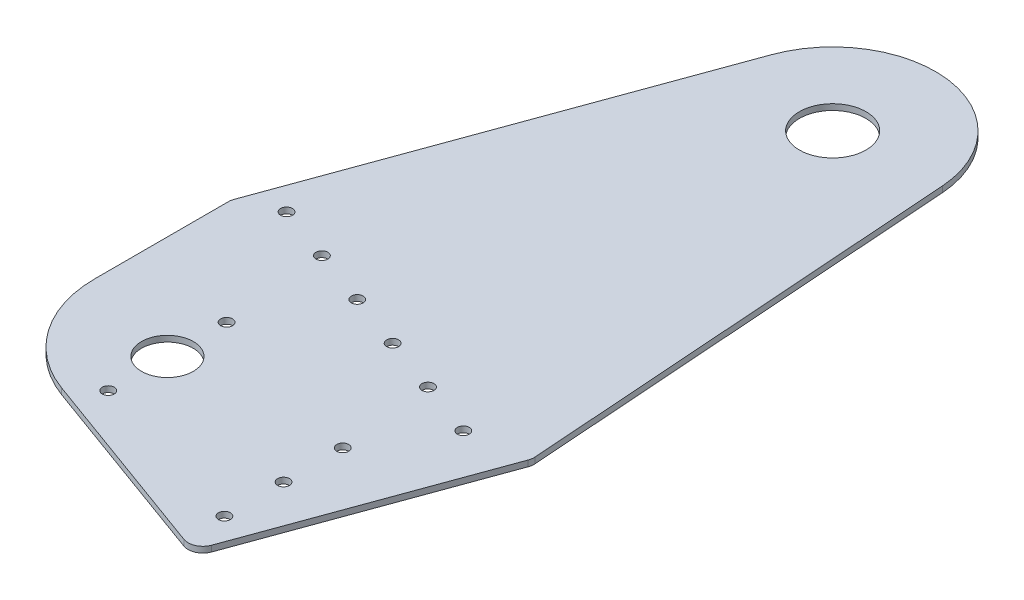
from build123d import *

# Parameters (mm, degrees)
SKETCH1_R                  = 14.2875
SKETCH1_R_2                = 11.1125
SKETCH1_R_3                = 2.5527
BOSS_EXTRUDE1_DEPTH        = 2.54
F_7_0_201_DIAMETER_HOLE1_D = 5.1054
CUT_EXTRUDE2_DEPTH         = 0.127


with BuildPart() as part:
    # Sketch1 → Boss-Extrude1 (new body)
    with BuildSketch(Plane(origin=(0, 0, 0), x_dir=(1, 0, 0), z_dir=(0, 1, 0))):
        with BuildLine():
            Line((0, 79.961539901), (0, 137.226043439))
            ThreePointArc((0, 137.226043439), (0.096470768, 138.328709367), (0.382951858, 139.397871349))
            Line((0.382951858, 139.397871349), (8.68731164, 162.213912335))
            Line((8.68731164, 162.213912335), (61.897095438, 308.406591813))
            ThreePointArc((61.897095438, 308.406591813), (109.5024689, 337.025784939), (147.412775028, 296.428513026))
            Line((147.412775028, 296.428513026), (160.751422837, 108.18172413))
            ThreePointArc((160.751422837, 108.18172413), (160.705914605, 106.852067788), (160.384352079, 105.56107804))
            Line((160.384352079, 105.56107804), (124.135089685, 5.967048142))
            ThreePointArc((124.135089685, 5.967048142), (120.851667505, 2.383821604), (115.996213633, 2.17182791))
            Line((115.996213633, 2.17182791), (33.425376719, 32.225154765))
            ThreePointArc((33.425376719, 32.225154765), (9.18707615, 50.823856935), (0, 79.961539901))
        make_face()
        with Locations((103.379027621, 293.308403239)):
            Circle(SKETCH1_R, mode=Mode.SUBTRACT)
        with Locations((44.45, 66.621712158)):
            Circle(SKETCH1_R_2, mode=Mode.SUBTRACT)
        with Locations((44.45, 92.021712158)):
            Circle(SKETCH1_R_3, mode=Mode.SUBTRACT)
        with Locations((44.45, 41.221712158)):
            Circle(SKETCH1_R_3, mode=Mode.SUBTRACT)
    extrude(amount=BOSS_EXTRUDE1_DEPTH)

    # #7 (0.201) Diameter Hole1 (through all)
    with Locations(Plane(origin=(0, 0, 0), x_dir=(-1, 0, 0), z_dir=(0, -1, 0))):
        with Locations((-135.618714944, 102.499602028), (-111.750522376, 111.186913669), (-87.882329808, 119.874225309), (-64.01413724, 128.56153695), (-40.145944672, 137.24884859), (-16.277752104, 145.936160231), (-116.079027621, 70.264108059), (-116.079027621, 44.864108059), (-116.079027621, 19.464108059)):
            Hole(F_7_0_201_DIAMETER_HOLE1_D / 2)

    # Sketch8 → Cut-Extrude2 (cut)
    with BuildSketch(Plane.XZ):
        with BuildLine():
            Line((142.678490111, -130.340522947), (147.199116848, -128.694042912))
            Line((147.199116848, -128.694042912), (147.461274834, -128.598131454))
            add(Edge.make_bspline(
                [(147.461274834, -128.598131454), (147.518382895, -128.578494473), (147.626739014, -128.541235514), (147.787225286, -128.51166484), (147.932937235, -128.507826746), (148.064673628, -128.525858863), (148.180584134, -128.569593537), (148.277897741, -128.640688135), (148.356925993, -128.734389109), (148.388285391, -128.811211473), (148.404404174, -128.850698294)],
                knots=[0, 0, 0, 0, 1.313667116, 2.492535482, 3.536993606, 4.475555594, 5.371860396, 6.202696431, 7.07618301, 8, 8, 8, 8], degree=3))
            add(Edge.make_bspline(
                [(148.404404174, -128.850698294), (148.424169517, -128.91612278), (148.461448654, -129.039518992), (148.440013448, -129.233024254), (148.352337864, -129.407393409), (148.254428083, -129.49515453), (148.202990111, -129.541260794)],
                knots=[0, 0, 0, 0, 1.048991658, 1.978488549, 2.93797689, 4, 4, 4, 4], degree=3))
            add(Edge.make_bspline(
                [(148.202990111, -129.541260794), (148.159429494, -129.576572856), (148.082907471, -129.638604816), (147.980715302, -129.718381547), (147.913280409, -129.778909029), (147.857086074, -129.825049715), (147.818175397, -129.89109086), (147.802772245, -129.946730628), (147.793767889, -129.979256454)],
                knots=[0, 0, 0, 0, 1.645585609, 2.890765756, 3.799650786, 4.308634086, 5.011263433, 6, 6, 6, 6], degree=3))
            add(Edge.make_bspline(
                [(147.793767889, -129.979256454), (147.785886213, -130.016395691), (147.768901756, -130.096428127), (147.774931396, -130.229069226), (147.805478092, -130.379334101), (147.841403635, -130.482653017), (147.86090591, -130.53873996)],
                knots=[0, 0, 0, 0, 0.793290123, 1.709484242, 2.756587552, 4, 4, 4, 4], degree=3))
            Line((147.86090591, -130.53873996), (151.531117716, -140.62223128))
            add(Edge.make_bspline(
                [(151.531117716, -140.62223128), (151.552552433, -140.674879266), (151.592342158, -140.772610853), (151.661839447, -140.903444941), (151.740998994, -141.006154518), (151.804985412, -141.053925387), (151.834837334, -141.076212183)],
                knots=[0, 0, 0, 0, 1.228251267, 2.280029168, 3.197572906, 4, 4, 4, 4], degree=3))
            add(Edge.make_bspline(
                [(151.834837334, -141.076212183), (151.861350797, -141.096403836), (151.907327023, -141.131417595), (151.980932967, -141.152552279), (152.052283582, -141.148502859), (152.142814391, -141.150860556), (152.27181157, -141.146168724), (152.370884771, -141.142310732), (152.426291327, -141.140153155)],
                knots=[0, 0, 0, 0, 0.97626264, 1.692908647, 2.195740748, 3.075696926, 4.364587386, 6, 6, 6, 6], degree=3))
            add(Edge.make_bspline(
                [(152.426291327, -141.140153155), (152.495265984, -141.140747157), (152.624906927, -141.14186361), (152.801921435, -141.216609752), (152.939953417, -141.347195219), (152.990802934, -141.462634179), (153.01774532, -141.523798988)],
                knots=[0, 0, 0, 0, 1.07887602, 2.02779556, 2.955036411, 4, 4, 4, 4], degree=3))
            add(Edge.make_bspline(
                [(153.01774532, -141.523798988), (153.028856949, -141.562842138), (153.050477636, -141.638811165), (153.056909688, -141.757617775), (153.019893966, -141.869546486), (152.962045496, -141.97703868), (152.874336038, -142.077424934), (152.754991794, -142.162088552), (152.614338132, -142.243321023), (152.507963878, -142.285063252), (152.451867716, -142.307075898)],
                knots=[0, 0, 0, 0, 0.895180691, 1.741816617, 2.574963405, 3.458649021, 4.425078252, 5.482965102, 6.672648756, 8, 8, 8, 8], degree=3))
            Line((152.451867716, -142.307075898), (152.18970973, -142.402987356))
            Line((152.18970973, -142.402987356), (147.669082993, -144.049467391))
            Line((147.669082993, -144.049467391), (147.406925007, -144.142181801))
            add(Edge.make_bspline(
                [(147.406925007, -144.142181801), (147.349745899, -144.16153136), (147.241066457, -144.198308767), (147.081237643, -144.231525583), (146.935409722, -144.239460583), (146.804132632, -144.221543928), (146.691343108, -144.175651309), (146.593380285, -144.110754032), (146.519008615, -144.01831589), (146.486720418, -143.94588159), (146.470189764, -143.908797252)],
                knots=[0, 0, 0, 0, 1.331017513, 2.529844268, 3.588880398, 4.539838543, 5.426110059, 6.254348996, 7.106275473, 8, 8, 8, 8], degree=3))
            add(Edge.make_bspline(
                [(146.470189764, -143.908797252), (146.451784765, -143.844376967), (146.417053282, -143.722811515), (146.437696868, -143.532807998), (146.525851114, -143.360482553), (146.625344339, -143.27582515), (146.677997924, -143.231022947)],
                knots=[0, 0, 0, 0, 1.042573949, 1.967407834, 2.924316062, 4, 4, 4, 4], degree=3))
            add(Edge.make_bspline(
                [(146.677997924, -143.231022947), (146.721974555, -143.197282855), (146.799624815, -143.137707421), (146.897327677, -143.055687447), (146.969571781, -143.002977485), (147.023622755, -142.955860948), (147.067010147, -142.892160854), (147.081836933, -142.835441769), (147.090417195, -142.802618433)],
                knots=[0, 0, 0, 0, 1.637578594, 2.891499403, 3.766902875, 4.279459033, 5.004322902, 6, 6, 6, 6], degree=3))
            add(Edge.make_bspline(
                [(147.090417195, -142.802618433), (147.09837975, -142.766541128), (147.115339801, -142.689697338), (147.108225734, -142.561652516), (147.082888987, -142.416320343), (147.048312135, -142.316256983), (147.029673271, -142.262317217)],
                knots=[0, 0, 0, 0, 0.799685466, 1.703310806, 2.761955671, 4, 4, 4, 4], degree=3))
            Line((147.029673271, -142.262317217), (143.359461466, -132.178825898))
            add(Edge.make_bspline(
                [(143.359461466, -132.178825898), (143.325423382, -132.095015579), (143.264017082, -131.943817829), (143.136177971, -131.759986022), (142.983761802, -131.638048072), (142.867743961, -131.625356564), (142.812766153, -131.619342391)],
                knots=[0, 0, 0, 0, 1.300292944, 2.345789501, 3.21611309, 4, 4, 4, 4], degree=3))
            Line((142.812766153, -131.619342391), (142.45149966, -131.635327634))
            add(Edge.make_bspline(
                [(142.45149966, -131.635327634), (142.383505038, -131.63490184), (142.2543355, -131.634092957), (142.077237377, -131.554495313), (141.937893982, -131.418414732), (141.884899127, -131.298936914), (141.856848618, -131.235696558)],
                knots=[0, 0, 0, 0, 1.045675563, 1.986472254, 2.934227166, 4, 4, 4, 4], degree=3))
            add(Edge.make_bspline(
                [(141.856848618, -131.235696558), (141.844587257, -131.193425544), (141.82100975, -131.112142147), (141.812614078, -130.988308401), (141.838612576, -130.871193314), (141.900676924, -130.767376393), (141.98594369, -130.668355478), (142.103112008, -130.580032771), (142.24921399, -130.500326292), (142.358245658, -130.456555946), (142.416332125, -130.433237356)],
                knots=[0, 0, 0, 0, 0.949533234, 1.825867897, 2.652690171, 3.498223352, 4.412470925, 5.462780625, 6.648299973, 8, 8, 8, 8], degree=3))
            Line((142.416332125, -130.433237356), (142.678490111, -130.340522947))
        make_face()
        with BuildLine():
            Line((142.256479695, -141.610119301), (136.354727959, -134.694903155))
            add(Edge.make_bspline(
                [(136.354727959, -134.694903155), (136.282693971, -134.611341769), (136.154587246, -134.462734482), (135.944269963, -134.291333932), (135.729421176, -134.182086075), (135.578011051, -134.165979079), (135.50111598, -134.157798988)],
                knots=[0, 0, 0, 0, 1.269579583, 2.257846421, 3.115230736, 4, 4, 4, 4], degree=3))
            add(Edge.make_bspline(
                [(135.50111598, -134.157798988), (135.433623459, -134.150079088), (135.324715424, -134.137622018), (135.218576534, -134.110547864), (135.17821407, -134.100252113)],
                knots=[0, 0, 0, 0, 1.239440611, 2, 2, 2, 2], degree=3))
            add(Edge.make_bspline(
                [(135.17821407, -134.100252113), (135.118952997, -134.062962779), (134.993975087, -133.984321894), (134.93452722, -133.848676368), (134.903267889, -133.777350204)],
                knots=[0, 0, 0, 0, 0.948344748, 2, 2, 2, 2], degree=3))
            add(Edge.make_bspline(
                [(134.903267889, -133.777350204), (134.889926791, -133.734041455), (134.864919241, -133.652860304), (134.853427032, -133.529592279), (134.87248326, -133.414585076), (134.922904454, -133.309868815), (134.99867301, -133.215286565), (135.101835683, -133.131494777), (135.229261488, -133.054377361), (135.327725117, -133.016982337), (135.379628132, -132.997270342)],
                knots=[0, 0, 0, 0, 1.03998122, 1.949418415, 2.819391159, 3.685214567, 4.592008043, 5.583233491, 6.726052746, 8, 8, 8, 8], degree=3))
            Line((135.379628132, -132.997270342), (140.456541327, -131.149376245))
            add(Edge.make_bspline(
                [(140.456541327, -131.149376245), (140.517863733, -131.128354033), (140.633470242, -131.088722441), (140.804929368, -131.060315622), (140.960607661, -131.054069111), (141.101258503, -131.079977172), (141.22416636, -131.131663926), (141.331703452, -131.206013333), (141.413122909, -131.313247515), (141.448404268, -131.396749235), (141.466808688, -131.440307669)],
                knots=[0, 0, 0, 0, 1.306819532, 2.463648305, 3.496779858, 4.437970598, 5.325217765, 6.173237362, 7.047074481, 8, 8, 8, 8], degree=3))
            add(Edge.make_bspline(
                [(141.466808688, -131.440307669), (141.481627461, -131.493256705), (141.511449099, -131.599812555), (141.479404138, -131.770707029), (141.394878419, -131.93753168), (141.304641514, -132.031861329), (141.25580348, -132.08291444)],
                knots=[0, 0, 0, 0, 0.90866313, 1.828614434, 2.82480229, 4, 4, 4, 4], degree=3))
            add(Edge.make_bspline(
                [(141.25580348, -132.08291444), (141.199856294, -132.141828615), (141.106715713, -132.239908625), (140.992611719, -132.37422139), (140.951451329, -132.508864898), (140.966543087, -132.59014908), (140.974463202, -132.632806801)],
                knots=[0, 0, 0, 0, 1.499726916, 2.496737491, 3.211091854, 4, 4, 4, 4], degree=3))
            add(Edge.make_bspline(
                [(140.974463202, -132.632806801), (140.981511892, -132.647967041), (140.998927828, -132.685425029), (141.04464333, -132.745994491), (141.102804795, -132.828811014), (141.151918679, -132.887880806), (141.179074313, -132.920541176)],
                knots=[0, 0, 0, 0, 0.565575118, 1.397425436, 2.561006461, 4, 4, 4, 4], degree=3))
            Line((141.179074313, -132.920541176), (143.931733167, -136.261456974))
            add(Edge.make_bspline(
                [(143.931733167, -136.261456974), (143.992822651, -136.336086686), (144.108436841, -136.477326275), (144.251477158, -136.694267991), (144.371460749, -136.89472262), (144.426678174, -137.031196108), (144.452852091, -137.095886662)],
                knots=[0, 0, 0, 0, 1.170241372, 2.214726656, 3.153752698, 4, 4, 4, 4], degree=3))
            add(Edge.make_bspline(
                [(144.452852091, -137.095886662), (144.470321072, -137.157264383), (144.507133537, -137.286605941), (144.511623348, -137.499537886), (144.486749013, -137.733355025), (144.44159093, -137.891404659), (144.417684556, -137.97507503)],
                knots=[0, 0, 0, 0, 0.853375566, 1.798322301, 2.834447219, 4, 4, 4, 4], degree=3))
            Line((144.417684556, -137.97507503), (143.058938896, -142.300681801))
            add(Edge.make_bspline(
                [(143.058938896, -142.300681801), (143.031537402, -142.399180702), (142.978550078, -142.589651816), (142.948416489, -142.878860128), (142.968539988, -143.158224795), (143.022557454, -143.332978588), (143.04934775, -143.419648815)],
                knots=[0, 0, 0, 0, 1.075096436, 2.078955324, 3.047245992, 4, 4, 4, 4], degree=3))
            add(Edge.make_bspline(
                [(143.04934775, -143.419648815), (143.068185986, -143.465099779), (143.105612577, -143.555398825), (143.187323238, -143.679356485), (143.291158481, -143.786850627), (143.408657563, -143.884136985), (143.542965087, -143.960380341), (143.68665906, -144.014014835), (143.837408037, -144.048354685), (143.94006954, -144.051207904), (143.992477091, -144.05266444)],
                knots=[0, 0, 0, 0, 0.974189936, 1.935457784, 2.922174346, 3.928831118, 4.95111638, 5.967706416, 6.962536819, 8, 8, 8, 8], degree=3))
            Line((143.992477091, -144.05266444), (144.459246188, -144.055861488))
            add(Edge.make_bspline(
                [(144.459246188, -144.055861488), (144.527177305, -144.058037625), (144.652913568, -144.062065519), (144.820367499, -144.129539488), (144.953593443, -144.235166526), (144.998880485, -144.334571168), (145.021926743, -144.385157495)],
                knots=[0, 0, 0, 0, 1.159630891, 2.146404475, 3.056718205, 4, 4, 4, 4], degree=3))
            add(Edge.make_bspline(
                [(145.021926743, -144.385157495), (145.034508339, -144.429550186), (145.059041528, -144.516112674), (145.062911946, -144.652335707), (145.03046591, -144.785865189), (144.984566585, -144.865636373), (144.96118282, -144.906276419)],
                knots=[0, 0, 0, 0, 1.014563119, 1.978323598, 2.970041326, 4, 4, 4, 4], degree=3))
            add(Edge.make_bspline(
                [(144.96118282, -144.906276419), (144.939963577, -144.934080658), (144.89417647, -144.994076939), (144.792784278, -145.065653881), (144.66823334, -145.13691318), (144.571803471, -145.174054272), (144.519990111, -145.194010794)],
                knots=[0, 0, 0, 0, 0.780956791, 1.685156822, 2.756196579, 4, 4, 4, 4], degree=3))
            Line((144.519990111, -145.194010794), (140.926507473, -146.501603676))
            add(Edge.make_bspline(
                [(140.926507473, -146.501603676), (140.865194019, -146.522641529), (140.748608754, -146.562644229), (140.574875821, -146.590956153), (140.415217076, -146.595880068), (140.270895342, -146.574222265), (140.141451905, -146.527812628), (140.037751179, -146.446745395), (139.95003204, -146.345976305), (139.915121476, -146.263130188), (139.89705782, -146.220263398)],
                knots=[0, 0, 0, 0, 1.293300657, 2.459163372, 3.502899085, 4.472757678, 5.362626851, 6.214478627, 7.076123646, 8, 8, 8, 8], degree=3))
            add(Edge.make_bspline(
                [(139.89705782, -146.220263398), (139.877590435, -146.152521572), (139.839696815, -146.020660869), (139.879017128, -145.812617378), (139.98362033, -145.618194767), (140.095760936, -145.514880754), (140.156018757, -145.459365829)],
                knots=[0, 0, 0, 0, 0.970145965, 1.888406845, 2.865352981, 4, 4, 4, 4], degree=3))
            Line((140.156018757, -145.459365829), (140.625984903, -145.050143606))
            add(Edge.make_bspline(
                [(140.625984903, -145.050143606), (140.67826941, -145.003294922), (140.792526904, -144.900916349), (140.952895338, -144.707514916), (141.129755127, -144.475876788), (141.241228761, -144.299827478), (141.30056216, -144.206122773)],
                knots=[0, 0, 0, 0, 0.775904004, 1.695585414, 2.773443132, 4, 4, 4, 4], degree=3))
            add(Edge.make_bspline(
                [(141.30056216, -144.206122773), (141.348908795, -144.120536567), (141.455248439, -143.932287547), (141.594059344, -143.608223154), (141.742333886, -143.225442887), (141.835653717, -142.947986245), (141.885622056, -142.799421384)],
                knots=[0, 0, 0, 0, 0.77236567, 1.698837777, 2.767836865, 4, 4, 4, 4], degree=3))
            Line((141.885622056, -142.799421384), (142.256479695, -141.610119301))
        make_face()
        with BuildLine():
            Line((127.693648674, -135.792302382), (132.214275411, -134.149019396))
            Line((132.214275411, -134.149019396), (132.476433397, -134.053107938))
            add(Edge.make_bspline(
                [(132.476433397, -134.053107938), (132.533541458, -134.033470958), (132.641897577, -133.996211998), (132.802383849, -133.966641324), (132.948095798, -133.96280323), (133.079832191, -133.980835347), (133.195742697, -134.024570022), (133.293056304, -134.095664619), (133.372084556, -134.189365594), (133.403443954, -134.266187957), (133.419562737, -134.305674778)],
                knots=[0, 0, 0, 0, 1.313667116, 2.492535482, 3.536993606, 4.475555594, 5.371860396, 6.202696431, 7.07618301, 8, 8, 8, 8], degree=3))
            add(Edge.make_bspline(
                [(133.419562737, -134.305674778), (133.43932808, -134.371099264), (133.476607217, -134.494495476), (133.455172011, -134.688000738), (133.367496427, -134.862369893), (133.269586646, -134.950131015), (133.218148674, -134.996237278)],
                knots=[0, 0, 0, 0, 1.048991658, 1.978488549, 2.93797689, 4, 4, 4, 4], degree=3))
            add(Edge.make_bspline(
                [(133.218148674, -134.996237278), (133.17446615, -135.031404761), (133.097729975, -135.093182742), (132.997274555, -135.173954937), (132.927609768, -135.230779478), (132.87234621, -135.276934859), (132.832655132, -135.343680808), (132.817747841, -135.400569221), (132.808926452, -135.434232938)],
                knots=[0, 0, 0, 0, 1.642959968, 2.886153347, 3.773498901, 4.281670084, 4.98317834, 6, 6, 6, 6], degree=3))
            add(Edge.make_bspline(
                [(132.808926452, -135.434232938), (132.801044776, -135.471372175), (132.784060319, -135.551404612), (132.790089959, -135.684045711), (132.820636655, -135.834310585), (132.856562198, -135.937629502), (132.876064473, -135.993716445)],
                knots=[0, 0, 0, 0, 0.793290123, 1.709484242, 2.756587552, 4, 4, 4, 4], degree=3))
            Line((132.876064473, -135.993716445), (136.546276279, -146.077207764))
            add(Edge.make_bspline(
                [(136.546276279, -146.077207764), (136.567710996, -146.129855751), (136.607500721, -146.227587337), (136.67699801, -146.358421426), (136.756157557, -146.461131003), (136.820143975, -146.508901871), (136.849995897, -146.531188667)],
                knots=[0, 0, 0, 0, 1.228251267, 2.280029168, 3.197572906, 4, 4, 4, 4], degree=3))
            add(Edge.make_bspline(
                [(136.849995897, -146.531188667), (136.876842759, -146.54950276), (136.923992106, -146.581666574), (136.995554905, -146.608252598), (137.067540453, -146.603182536), (137.157924687, -146.605982766), (137.286988407, -146.601090035), (137.386049888, -146.597267427), (137.44144989, -146.595129639)],
                knots=[0, 0, 0, 0, 0.960695384, 1.687204976, 2.190702953, 3.071824414, 4.362421688, 6, 6, 6, 6], degree=3))
            add(Edge.make_bspline(
                [(137.44144989, -146.595129639), (137.510424547, -146.595723641), (137.64006549, -146.596840094), (137.817079998, -146.671586236), (137.95511198, -146.802171704), (138.005961497, -146.917610663), (138.032903883, -146.978775472)],
                knots=[0, 0, 0, 0, 1.07887602, 2.02779556, 2.955036411, 4, 4, 4, 4], degree=3))
            add(Edge.make_bspline(
                [(138.032903883, -146.978775472), (138.044015512, -147.017818622), (138.065636199, -147.093787649), (138.072068251, -147.212594259), (138.035052529, -147.32452297), (137.977204059, -147.432015164), (137.889494601, -147.532401418), (137.770150357, -147.617065036), (137.629496695, -147.698297507), (137.523122441, -147.740039736), (137.467026279, -147.762052382)],
                knots=[0, 0, 0, 0, 0.895180691, 1.741816617, 2.574963405, 3.458649021, 4.425078252, 5.482965102, 6.672648756, 8, 8, 8, 8], degree=3))
            Line((137.467026279, -147.762052382), (137.204868293, -147.857963841))
            Line((137.204868293, -147.857963841), (132.684241556, -149.501246827))
            Line((132.684241556, -149.501246827), (132.42208357, -149.597158285))
            add(Edge.make_bspline(
                [(132.42208357, -149.597158285), (132.364979731, -149.616936371), (132.256631623, -149.654463064), (132.096056924, -149.682257153), (131.950479203, -149.69179075), (131.82008351, -149.672245681), (131.705808733, -149.631387789), (131.608638014, -149.565469489), (131.534140656, -149.473362184), (131.501870001, -149.400881712), (131.485348327, -149.363773736)],
                knots=[0, 0, 0, 0, 1.333158671, 2.529518515, 3.590258276, 4.542746192, 5.421969539, 6.251540833, 7.104837772, 8, 8, 8, 8], degree=3))
            add(Edge.make_bspline(
                [(131.485348327, -149.363773736), (131.466943328, -149.299353451), (131.432211845, -149.177787999), (131.452855431, -148.987784482), (131.541009677, -148.815459037), (131.640502902, -148.730801634), (131.693156487, -148.685999431)],
                knots=[0, 0, 0, 0, 1.042573949, 1.967407834, 2.924316062, 4, 4, 4, 4], degree=3))
            add(Edge.make_bspline(
                [(131.693156487, -148.685999431), (131.736945093, -148.65203029), (131.814263352, -148.592050421), (131.9143428, -148.511879557), (131.982388095, -148.454117423), (132.040099452, -148.411298891), (132.081788544, -148.34670014), (132.09685614, -148.29025799), (132.105575758, -148.257594917)],
                knots=[0, 0, 0, 0, 1.637886797, 2.892043602, 3.787214444, 4.279135215, 5.004135509, 6, 6, 6, 6], degree=3))
            add(Edge.make_bspline(
                [(132.105575758, -148.257594917), (132.113509178, -148.221516208), (132.130636885, -148.143624768), (132.123544396, -148.014486114), (132.098054889, -147.868098939), (132.063473268, -147.768036124), (132.044831834, -147.714096653)],
                knots=[0, 0, 0, 0, 0.79508296, 1.716529161, 2.769081105, 4, 4, 4, 4], degree=3))
            Line((132.044831834, -147.714096653), (128.374620029, -137.630605334))
            add(Edge.make_bspline(
                [(128.374620029, -137.630605334), (128.353997268, -137.575395965), (128.315610826, -137.472631293), (128.23656088, -137.341686181), (128.158718616, -137.234026993), (128.094463421, -137.183974637), (128.064506313, -137.160639188)],
                knots=[0, 0, 0, 0, 1.234302847, 2.297485558, 3.206252361, 4, 4, 4, 4], degree=3))
            add(Edge.make_bspline(
                [(128.064506313, -137.160639188), (128.037869025, -137.140638819), (127.990616409, -137.105159616), (127.916571669, -137.082316023), (127.843909365, -137.080119351), (127.753322872, -137.080396865), (127.624387364, -137.084611628), (127.525271915, -137.086212181), (127.469855272, -137.08710707)],
                knots=[0, 0, 0, 0, 0.969960246, 1.720639127, 2.221199932, 3.095475435, 4.37604529, 6, 6, 6, 6], degree=3))
            add(Edge.make_bspline(
                [(127.469855272, -137.08710707), (127.400816409, -137.085321433), (127.269725425, -137.081930866), (127.09108084, -137.004012505), (126.949572166, -136.871302092), (126.898778745, -136.753017179), (126.872007181, -136.690673042)],
                knots=[0, 0, 0, 0, 1.06378334, 2.019911687, 2.956359742, 4, 4, 4, 4], degree=3))
            add(Edge.make_bspline(
                [(126.872007181, -136.690673042), (126.858888191, -136.64949916), (126.833712994, -136.570486943), (126.836705551, -136.447432606), (126.859646952, -136.329641251), (126.922118206, -136.221494922), (127.009691634, -136.121192645), (127.127271181, -136.03273052), (127.269178366, -135.952204067), (127.375449111, -135.910307747), (127.431490688, -135.888213841)],
                knots=[0, 0, 0, 0, 0.932211671, 1.788903752, 2.642775182, 3.513125535, 4.464970859, 5.520948435, 6.692679159, 8, 8, 8, 8], degree=3))
            Line((127.431490688, -135.888213841), (127.693648674, -135.792302382))
        make_face()
        with BuildLine():
            Line((122.380044888, -153.252150331), (118.089605652, -141.46782915))
            add(Edge.make_bspline(
                [(118.089605652, -141.46782915), (118.065670848, -141.406282924), (118.021623064, -141.29301795), (117.936644784, -141.145927533), (117.847319011, -141.029245143), (117.772356007, -140.979257495), (117.737930304, -140.956301373)],
                knots=[0, 0, 0, 0, 1.250237205, 2.300841063, 3.21968522, 4, 4, 4, 4], degree=3))
            add(Edge.make_bspline(
                [(117.737930304, -140.956301373), (117.702648895, -140.936253277), (117.640789693, -140.901102775), (117.549987824, -140.878815541), (117.465074928, -140.887981141), (117.361618555, -140.892078421), (117.215788732, -140.90703637), (117.103861154, -140.916062456), (117.040973707, -140.921133838)],
                knots=[0, 0, 0, 0, 1.022213475, 1.792255813, 2.303892836, 3.166085326, 4.407741288, 6, 6, 6, 6], degree=3))
            add(Edge.make_bspline(
                [(117.040973707, -140.921133838), (116.961668707, -140.926618044), (116.81458413, -140.936789434), (116.60800719, -140.869491756), (116.444727492, -140.733198926), (116.38914151, -140.604798029), (116.360002353, -140.537488005)],
                knots=[0, 0, 0, 0, 1.108769337, 2.056400824, 2.98113088, 4, 4, 4, 4], degree=3))
            add(Edge.make_bspline(
                [(116.360002353, -140.537488005), (116.347969189, -140.494162341), (116.324168725, -140.408468261), (116.331509274, -140.272520768), (116.379693469, -140.13837988), (116.435635851, -140.058838377), (116.465504957, -140.016369081)],
                knots=[0, 0, 0, 0, 0.965229799, 1.909133572, 2.883631534, 4, 4, 4, 4], degree=3))
            add(Edge.make_bspline(
                [(116.465504957, -140.016369081), (116.494196903, -139.984181106), (116.557641381, -139.913006105), (116.690677596, -139.826241042), (116.85774028, -139.739762817), (116.984938372, -139.691050619), (117.053761902, -139.664693734)],
                knots=[0, 0, 0, 0, 0.743719897, 1.644535382, 2.725520262, 4, 4, 4, 4], degree=3))
            Line((117.053761902, -139.664693734), (117.37986086, -139.546402935))
            Line((117.37986086, -139.546402935), (121.900487596, -137.903119949))
            Line((121.900487596, -137.903119949), (122.229783603, -137.781632102))
            add(Edge.make_bspline(
                [(122.229783603, -137.781632102), (122.298562024, -137.757503761), (122.427962944, -137.712108279), (122.61825042, -137.674192728), (122.78832568, -137.657897117), (122.939092506, -137.67405895), (123.069542051, -137.713523007), (123.177773308, -137.784656504), (123.263456217, -137.883055627), (123.298608221, -137.963723869), (123.316780131, -138.005425505)],
                knots=[0, 0, 0, 0, 1.399553308, 2.633143998, 3.722140047, 4.670177317, 5.531926726, 6.316143072, 7.129526246, 8, 8, 8, 8], degree=3))
            add(Edge.make_bspline(
                [(123.316780131, -138.005425505), (123.337685621, -138.076226566), (123.377169432, -138.209947211), (123.340565879, -138.418688517), (123.226788292, -138.602940423), (123.106579984, -138.688349794), (123.04183395, -138.734352588)],
                knots=[0, 0, 0, 0, 1.027586927, 1.940784261, 2.890874887, 4, 4, 4, 4], degree=3))
            add(Edge.make_bspline(
                [(123.04183395, -138.734352588), (122.988440011, -138.77148418), (122.894264995, -138.836976039), (122.772545956, -138.924594234), (122.685990211, -138.984363823), (122.617473562, -139.034682371), (122.565508768, -139.108292591), (122.547159073, -139.173529599), (122.53670027, -139.210712831)],
                knots=[0, 0, 0, 0, 1.641171953, 2.894661773, 3.782439402, 4.298979607, 5.030466937, 6, 6, 6, 6], degree=3))
            add(Edge.make_bspline(
                [(122.53670027, -139.210712831), (122.525372989, -139.250913146), (122.5009897, -139.337449005), (122.500584689, -139.485000474), (122.531839462, -139.652626521), (122.570314669, -139.768495203), (122.591050096, -139.830940262)],
                knots=[0, 0, 0, 0, 0.786847088, 1.693779954, 2.757109838, 4, 4, 4, 4], degree=3))
            Line((122.591050096, -139.830940262), (126.881489332, -151.615261442))
            Line((126.881489332, -151.615261442), (122.380044888, -153.252150331))
        make_face()
        with BuildLine():
            Line((118.901655999, -154.518181581), (117.431013638, -150.480309185))
            add(Edge.make_bspline(
                [(117.431013638, -150.480309185), (117.415596471, -150.431701779), (117.386217348, -150.339074971), (117.368149419, -150.196947812), (117.38248591, -150.062564967), (117.417054822, -149.935010806), (117.476659816, -149.821003556), (117.560402283, -149.724626206), (117.663692112, -149.6463787), (117.744482653, -149.612228135), (117.785886034, -149.59472672)],
                knots=[0, 0, 0, 0, 1.142059975, 2.176322057, 3.184311098, 4.152438217, 5.124977301, 6.039749157, 6.995414421, 8, 8, 8, 8], degree=3))
            add(Edge.make_bspline(
                [(117.785886034, -149.59472672), (117.827049569, -149.581249096), (117.906935204, -149.555093215), (118.031382201, -149.545764998), (118.152459338, -149.561812107), (118.308382976, -149.619702708), (118.493014349, -149.750835558), (118.593042556, -149.901805277), (118.64589211, -149.981569602)],
                knots=[0, 0, 0, 0, 0.752527784, 1.460422663, 2.153796339, 2.864608379, 4.343426758, 6, 6, 6, 6], degree=3))
            Line((118.64589211, -149.981569602), (118.971991068, -150.553841303))
            add(Edge.make_bspline(
                [(118.971991068, -150.553841303), (119.05416302, -150.694445361), (119.214288272, -150.968434959), (119.501023411, -151.336266138), (119.802168563, -151.668533606), (120.029877809, -151.853427283), (120.14211086, -151.944557449)],
                knots=[0, 0, 0, 0, 1.066855509, 2.078939379, 3.053150017, 4, 4, 4, 4], degree=3))
            add(Edge.make_bspline(
                [(120.14211086, -151.944557449), (120.21439522, -151.995652458), (120.358795566, -152.097723461), (120.59998004, -152.214647293), (120.856016705, -152.311166129), (121.037629793, -152.345770769), (121.129998881, -152.363370817)],
                knots=[0, 0, 0, 0, 0.978988362, 1.955696357, 2.960259616, 4, 4, 4, 4], degree=3))
            Line((121.129998881, -152.363370817), (121.561600443, -153.549475852))
            Line((121.561600443, -153.549475852), (118.901655999, -154.518181581))
        make_face()
        with BuildLine():
            Line((130.359878221, -150.349230192), (127.699933777, -151.314738873))
            Line((127.699933777, -151.314738873), (127.268332214, -150.128633838))
            add(Edge.make_bspline(
                [(127.268332214, -150.128633838), (127.328142312, -150.055613194), (127.445853409, -149.911902677), (127.580795947, -149.672704247), (127.690697985, -149.42824598), (127.735271523, -149.257694811), (127.757480652, -149.172716303)],
                knots=[0, 0, 0, 0, 1.042765101, 2.052245816, 3.029515627, 4, 4, 4, 4], degree=3))
            add(Edge.make_bspline(
                [(127.757480652, -149.172716303), (127.784454049, -149.031416369), (127.839474844, -148.74319036), (127.856207951, -148.295557076), (127.836639859, -147.829550033), (127.784361724, -147.517332758), (127.757480652, -147.356792692)],
                knots=[0, 0, 0, 0, 0.943126269, 1.923804995, 2.932434208, 4, 4, 4, 4], degree=3))
            Line((127.757480652, -147.356792692), (127.635992804, -146.707791824))
            add(Edge.make_bspline(
                [(127.635992804, -146.707791824), (127.624896585, -146.611530694), (127.604088684, -146.431019474), (127.666928934, -146.214340782), (127.745856218, -146.068443125), (127.832442619, -145.983630444), (127.930572361, -145.908119157), (128.007967938, -145.876892084), (128.048412075, -145.860573942)],
                knots=[0, 0, 0, 0, 1.676489011, 3.143793093, 3.852413562, 4.549951533, 5.242256962, 6, 6, 6, 6], degree=3))
            add(Edge.make_bspline(
                [(128.048412075, -145.860573942), (128.091704513, -145.8467602), (128.175841758, -145.819913705), (128.30586856, -145.815294147), (128.432474032, -145.832736344), (128.549604349, -145.886865113), (128.658607968, -145.959391454), (128.754267412, -146.055883213), (128.834477961, -146.173700613), (128.870673074, -146.264692366), (128.88923586, -146.311357796)],
                knots=[0, 0, 0, 0, 1.013707022, 1.970101903, 2.888785409, 3.851420622, 4.831666476, 5.811039318, 6.877384076, 8, 8, 8, 8], degree=3))
            Line((128.88923586, -146.311357796), (130.359878221, -150.349230192))
        make_face()
        with BuildLine():
            Line((112.120776719, -156.986029784), (107.130183837, -143.277085339))
            Line((107.130183837, -143.277085339), (111.641219428, -141.636999402))
            Line((111.641219428, -141.636999402), (111.903377414, -141.541087943))
            add(Edge.make_bspline(
                [(111.903377414, -141.541087943), (111.960485476, -141.521450963), (112.068841595, -141.484192004), (112.229327867, -141.45462133), (112.375039815, -141.450783236), (112.506776208, -141.468815353), (112.622686714, -141.512550027), (112.720000321, -141.583644625), (112.799028573, -141.677345599), (112.830387972, -141.754167963), (112.846506754, -141.793654784)],
                knots=[0, 0, 0, 0, 1.313667116, 2.492535482, 3.536993606, 4.475555594, 5.371860396, 6.202696431, 7.07618301, 8, 8, 8, 8], degree=3))
            add(Edge.make_bspline(
                [(112.846506754, -141.793654784), (112.866272097, -141.85907927), (112.903551234, -141.982475482), (112.882116028, -142.175980744), (112.794440444, -142.350349899), (112.696530663, -142.43811102), (112.645092692, -142.484217284)],
                knots=[0, 0, 0, 0, 1.048991658, 1.978488549, 2.93797689, 4, 4, 4, 4], degree=3))
            add(Edge.make_bspline(
                [(112.645092692, -142.484217284), (112.601410167, -142.519384767), (112.524673992, -142.581162748), (112.424218572, -142.661934943), (112.354553785, -142.718759484), (112.299290227, -142.764914865), (112.25959915, -142.831660813), (112.244691858, -142.888549227), (112.235870469, -142.922212943)],
                knots=[0, 0, 0, 0, 1.642959968, 2.886153347, 3.773498901, 4.281670084, 4.98317834, 6, 6, 6, 6], degree=3))
            add(Edge.make_bspline(
                [(112.235870469, -142.922212943), (112.227988793, -142.959352181), (112.211004336, -143.039384617), (112.217033976, -143.172025716), (112.247580672, -143.322290591), (112.283506215, -143.425609507), (112.30300849, -143.48169645)],
                knots=[0, 0, 0, 0, 0.793290123, 1.709484242, 2.756587552, 4, 4, 4, 4], degree=3))
            Line((112.30300849, -143.48169645), (115.973220296, -153.56518777))
            add(Edge.make_bspline(
                [(115.973220296, -153.56518777), (115.994655013, -153.617835756), (116.034444738, -153.715567343), (116.103942027, -153.846401431), (116.183101575, -153.949111008), (116.247087992, -153.996881877), (116.276939914, -154.019168673)],
                knots=[0, 0, 0, 0, 1.228251267, 2.280029168, 3.197572906, 4, 4, 4, 4], degree=3))
            add(Edge.make_bspline(
                [(116.276939914, -154.019168673), (116.303786776, -154.037482765), (116.350936123, -154.06964658), (116.422498923, -154.096232604), (116.49448447, -154.091162541), (116.584868704, -154.093962771), (116.713932424, -154.089070041), (116.812993905, -154.085247433), (116.868393907, -154.083109645)],
                knots=[0, 0, 0, 0, 0.960695384, 1.687204976, 2.190702953, 3.071824414, 4.362421688, 6, 6, 6, 6], degree=3))
            add(Edge.make_bspline(
                [(116.868393907, -154.083109645), (116.937368564, -154.083703647), (117.067009507, -154.0848201), (117.244024015, -154.159566241), (117.382055997, -154.290151709), (117.432905514, -154.405590669), (117.4598479, -154.466755478)],
                knots=[0, 0, 0, 0, 1.07887602, 2.02779556, 2.955036411, 4, 4, 4, 4], degree=3))
            add(Edge.make_bspline(
                [(117.4598479, -154.466755478), (117.47095953, -154.505798627), (117.492580216, -154.581767655), (117.499012269, -154.700574265), (117.461996546, -154.812502976), (117.404148076, -154.91999517), (117.316438618, -155.020381424), (117.197094374, -155.105045042), (117.056440712, -155.186277513), (116.950066458, -155.228019741), (116.893970296, -155.250032388)],
                knots=[0, 0, 0, 0, 0.895180691, 1.741816617, 2.574963405, 3.458649021, 4.425078252, 5.482965102, 6.672648756, 8, 8, 8, 8], degree=3))
            Line((116.893970296, -155.250032388), (116.63181231, -155.345943846))
            Line((116.63181231, -155.345943846), (112.120776719, -156.986029784))
        make_face()
        with BuildLine():
            add(Edge.make_bspline(
                [(106.736946858, -151.528667805), (106.580368334, -151.551597644), (106.285676377, -151.594753239), (105.869163835, -151.647334703), (105.506567313, -151.680295051), (105.100234048, -151.697882341), (104.640099133, -151.684003081), (104.28959249, -151.618282701), (104.118564046, -151.58621468)],
                knots=[0, 0, 0, 0, 1.080962351, 2.034448284, 2.867506985, 3.56695295, 4.812803526, 6, 6, 6, 6], degree=3))
            add(Edge.make_bspline(
                [(104.118564046, -151.58621468), (103.980935694, -151.551664346), (103.707939463, -151.483131151), (103.321730584, -151.313530337), (102.964276999, -151.09430098), (102.636749877, -150.827236281), (102.343484923, -150.516909924), (102.085629647, -150.168360586), (101.865260245, -149.782270314), (101.754733984, -149.503274354), (101.698398247, -149.361068846)],
                knots=[0, 0, 0, 0, 0.989670594, 1.96308637, 2.931967109, 3.910746254, 4.905803952, 5.906164368, 6.932762464, 8, 8, 8, 8], degree=3))
            add(Edge.make_bspline(
                [(101.698398247, -149.361068846), (101.650305118, -149.219203499), (101.556472588, -148.942415838), (101.474373318, -148.519092134), (101.438076574, -148.10643672), (101.449634994, -147.701432847), (101.514712865, -147.306267403), (101.628110635, -146.920263709), (101.787157513, -146.541627331), (101.931759872, -146.306169944), (102.005314914, -146.186399575)],
                knots=[0, 0, 0, 0, 1.083241915, 2.113468867, 3.112168566, 4.076895179, 5.038161543, 6.002394595, 6.983875856, 8, 8, 8, 8], degree=3))
            add(Edge.make_bspline(
                [(102.005314914, -146.186399575), (102.088184717, -146.065247298), (102.253408721, -145.823696533), (102.54344784, -145.494013481), (102.86427757, -145.195994257), (103.222401171, -144.923055634), (103.634340018, -144.672142881), (104.108533007, -144.426414173), (104.654731561, -144.188264769), (105.045044907, -144.039495017), (105.250319254, -143.961253742)],
                knots=[0, 0, 0, 0, 0.87740918, 1.749359253, 2.619910027, 3.493280424, 4.437955592, 5.501477256, 6.685972101, 8, 8, 8, 8], degree=3))
            Line((105.250319254, -143.961253742), (106.465197726, -143.520061034))
            Line((106.465197726, -143.520061034), (106.852040608, -144.581481173))
            add(Edge.make_bspline(
                [(106.852040608, -144.581481173), (106.735360467, -144.637102115), (106.527348513, -144.736260556), (106.261800292, -144.912042004), (106.066539286, -145.118433816), (105.989916863, -145.281047324), (105.9504729, -145.364758082)],
                knots=[0, 0, 0, 0, 1.263091124, 2.251780397, 3.100045321, 4, 4, 4, 4], degree=3))
            add(Edge.make_bspline(
                [(105.9504729, -145.364758082), (105.924073942, -145.45248385), (105.86836775, -145.637599813), (105.86516254, -145.948175749), (105.922947406, -146.290325191), (105.999337252, -146.522967443), (106.039990261, -146.646774575)],
                knots=[0, 0, 0, 0, 0.834986822, 1.761961086, 2.808964508, 4, 4, 4, 4], degree=3))
            Line((106.039990261, -146.646774575), (106.880814046, -148.955043673))
            add(Edge.make_bspline(
                [(106.880814046, -148.955043673), (106.911220969, -149.034090977), (106.968353461, -149.182615358), (107.056742016, -149.39017702), (107.149557242, -149.564359681), (107.266468884, -149.75886388), (107.450249663, -149.960905081), (107.632137448, -150.071829107), (107.724834879, -150.128360513)],
                knots=[0, 0, 0, 0, 1.028417399, 1.932324686, 2.736859612, 3.422647556, 4.686476113, 6, 6, 6, 6], degree=3))
            add(Edge.make_bspline(
                [(107.724834879, -150.128360513), (107.795823749, -150.165247727), (107.931642977, -150.23582207), (108.166693407, -150.279546922), (108.431309114, -150.261830258), (108.61933063, -150.227611129), (108.725511094, -150.208286728)],
                knots=[0, 0, 0, 0, 0.927459874, 1.774459626, 2.743181552, 4, 4, 4, 4], degree=3))
            Line((108.725511094, -150.208286728), (109.109156928, -151.26331277))
            add(Edge.make_bspline(
                [(109.109156928, -151.26331277), (109.013064851, -151.311091839), (108.842277341, -151.3960111), (108.622920705, -151.54336285), (108.462761354, -151.713626059), (108.395340071, -151.845326686), (108.361047553, -151.912313638)],
                knots=[0, 0, 0, 0, 1.269389684, 2.256126725, 3.113012912, 4, 4, 4, 4], degree=3))
            add(Edge.make_bspline(
                [(108.361047553, -151.912313638), (108.334616612, -151.987287007), (108.278811475, -152.145582511), (108.25474343, -152.399597797), (108.254409224, -152.651454842), (108.292196135, -152.80997072), (108.309894775, -152.884216416)],
                knots=[0, 0, 0, 0, 0.96112015, 2.029267212, 3.076947823, 4, 4, 4, 4], degree=3))
            Line((108.309894775, -152.884216416), (108.511308837, -153.440502874))
            Line((108.511308837, -153.440502874), (109.112353976, -155.086982909))
            add(Edge.make_bspline(
                [(109.112353976, -155.086982909), (109.15145833, -155.177793016), (109.232727339, -155.366520015), (109.401230025, -155.622719058), (109.589073795, -155.84732338), (109.73598783, -155.959724245), (109.802916476, -156.010929957)],
                knots=[0, 0, 0, 0, 1.013245932, 2.105788328, 3.137066629, 4, 4, 4, 4], degree=3))
            add(Edge.make_bspline(
                [(109.802916476, -156.010929957), (109.893778249, -156.059104772), (110.067846519, -156.151395583), (110.365794764, -156.217192698), (110.696637428, -156.199428216), (110.925814465, -156.14810427), (111.052962483, -156.11962961)],
                knots=[0, 0, 0, 0, 0.951114468, 1.822095741, 2.79169303, 4, 4, 4, 4], degree=3))
            Line((111.052962483, -156.11962961), (111.455790608, -157.229005478))
            Line((111.455790608, -157.229005478), (110.276079671, -157.657409992))
            add(Edge.make_bspline(
                [(110.276079671, -157.657409992), (110.087230242, -157.7240603), (109.720350474, -157.853542554), (109.172182526, -157.997432727), (108.650222826, -158.11110737), (108.149502548, -158.173130414), (107.672784979, -158.202708699), (107.220034094, -158.182430228), (106.790560661, -158.125074483), (106.518877574, -158.049464996), (106.385271511, -158.012282388)],
                knots=[0, 0, 0, 0, 1.208562379, 2.347886829, 3.419198761, 4.431115781, 5.391160613, 6.299173738, 7.163581718, 8, 8, 8, 8], degree=3))
            add(Edge.make_bspline(
                [(106.385271511, -158.012282388), (106.267696771, -157.972997075), (106.035985882, -157.895575388), (105.716155278, -157.722655163), (105.413980328, -157.529635545), (105.143657953, -157.295429789), (104.903365176, -157.030976971), (104.689627612, -156.742754415), (104.513563633, -156.424626068), (104.423122568, -156.198478617), (104.377524983, -156.084462075)],
                knots=[0, 0, 0, 0, 1.028382661, 2.026689241, 3.011785208, 4.004180633, 4.988440068, 5.976954447, 6.98004308, 8, 8, 8, 8], degree=3))
            add(Edge.make_bspline(
                [(104.377524983, -156.084462075), (104.339966508, -155.967914565), (104.265783837, -155.737718699), (104.19672655, -155.381785562), (104.176932609, -155.022137608), (104.190520578, -154.660485696), (104.25176811, -154.305315713), (104.352627395, -153.962683615), (104.48798618, -153.6330157), (104.612318383, -153.430473523), (104.674850504, -153.328606173)],
                knots=[0, 0, 0, 0, 1.022082567, 2.018740506, 3.017462579, 4.024123524, 5.035141904, 6.018035621, 7.00318313, 8, 8, 8, 8], degree=3))
            add(Edge.make_bspline(
                [(104.674850504, -153.328606173), (104.72353674, -153.251952839), (104.821873388, -153.097128136), (104.997702412, -152.879841608), (105.190783382, -152.669099704), (105.414128723, -152.465266909), (105.671848087, -152.253318296), (105.979747891, -152.028485531), (106.338421759, -151.781257162), (106.598860119, -151.616188618), (106.736946858, -151.528667805)],
                knots=[0, 0, 0, 0, 0.788257032, 1.59212463, 2.424125713, 3.269209056, 4.216294617, 5.321677984, 6.579929799, 8, 8, 8, 8], degree=3))
        make_face()
        with BuildLine():
            add(Edge.make_bspline(
                [(98.194101766, -161.158270362), (98.270073597, -161.095917942), (98.413676173, -160.978058888), (98.595878412, -160.787357786), (98.726515827, -160.592160824), (98.816950696, -160.39293887), (98.853064263, -160.176169278), (98.85307322, -159.94041675), (98.804813013, -159.681012771), (98.746304192, -159.505777585), (98.71522069, -159.41268182)],
                knots=[0, 0, 0, 0, 1.181739463, 2.233733589, 3.158035706, 3.996203798, 4.843437646, 5.779134428, 6.82013891, 8, 8, 8, 8], degree=3))
            Line((98.71522069, -159.41268182), (95.435048815, -150.400201785))
            add(Edge.make_bspline(
                [(95.435048815, -150.400201785), (95.382495259, -150.263539306), (95.285226625, -150.010597854), (95.110067365, -149.679627488), (94.928665206, -149.418319728), (94.780208053, -149.297816308), (94.712515829, -149.242870188)],
                knots=[0, 0, 0, 0, 1.268721404, 2.348210247, 3.246831025, 4, 4, 4, 4], degree=3))
            add(Edge.make_bspline(
                [(94.712515829, -149.242870188), (94.655166603, -149.208169921), (94.534947783, -149.135429179), (94.317581415, -149.077060203), (94.067692293, -149.060507504), (93.891869924, -149.075191477), (93.798159926, -149.083017757)],
                knots=[0, 0, 0, 0, 0.844605885, 1.770512551, 2.811725347, 4, 4, 4, 4], degree=3))
            Line((93.798159926, -149.083017757), (93.392134752, -147.967247792))
            add(Edge.make_bspline(
                [(93.392134752, -147.967247792), (93.582220106, -147.919344493), (93.957413975, -147.824792104), (94.525536009, -147.739067325), (95.086106911, -147.702790663), (95.63826409, -147.719287737), (96.182727467, -147.783902541), (96.720246748, -147.89527105), (97.250358782, -148.057889845), (97.591059025, -148.203892581), (97.762500204, -148.277361507)],
                knots=[0, 0, 0, 0, 1.050828565, 2.074144205, 3.076301083, 4.059753313, 5.032384468, 6.013175928, 7.000225368, 8, 8, 8, 8], degree=3))
            add(Edge.make_bspline(
                [(97.762500204, -148.277361507), (97.982040587, -148.385846922), (98.420256631, -148.602390451), (99.021936322, -149.027889333), (99.586980895, -149.512253105), (100.104578353, -150.070967425), (100.577625068, -150.700651042), (101.003976966, -151.399784122), (101.392142943, -152.167511828), (101.60267901, -152.714932992), (101.710855238, -152.996205257)],
                knots=[0, 0, 0, 0, 0.928534843, 1.853412389, 2.788693912, 3.750676258, 4.738803779, 5.774232866, 6.85637128, 8, 8, 8, 8], degree=3))
            add(Edge.make_bspline(
                [(101.710855238, -152.996205257), (101.808354007, -153.283562753), (101.998747623, -153.844708638), (102.198473913, -154.695153728), (102.314121486, -155.526849017), (102.350943419, -156.338371951), (102.307204804, -157.124968863), (102.182759811, -157.883094434), (101.977523063, -158.613785826), (101.772058109, -159.071737768), (101.669293606, -159.300785119)],
                knots=[0, 0, 0, 0, 1.12354981, 2.194045263, 3.230189029, 4.229852067, 5.198569233, 6.142816108, 7.07111858, 8, 8, 8, 8], degree=3))
            add(Edge.make_bspline(
                [(101.669293606, -159.300785119), (101.584001331, -159.46882454), (101.415705093, -159.800395041), (101.112433994, -160.259485782), (100.782245646, -160.683021446), (100.416007335, -161.065596548), (100.012360188, -161.408578626), (99.575099346, -161.722557782), (99.095307128, -161.997047896), (98.753927021, -162.149058544), (98.580944648, -162.226084598)],
                knots=[0, 0, 0, 0, 1.037757138, 2.047672211, 3.02633358, 3.994133099, 4.960452542, 5.94148984, 6.956922313, 8, 8, 8, 8], degree=3))
            Line((98.580944648, -162.226084598), (98.194101766, -161.158270362))
        make_face()
        with BuildLine():
            Line((97.375657322, -161.455595882), (97.762500204, -162.523410119))
            add(Edge.make_bspline(
                [(97.762500204, -162.523410119), (97.580030778, -162.575920272), (97.220644743, -162.679342618), (96.675175888, -162.772202358), (96.138502171, -162.824042064), (95.608211988, -162.816378375), (95.081525771, -162.758234921), (94.556286997, -162.648233533), (94.029069824, -162.489323726), (93.687182535, -162.344409399), (93.513622599, -162.270843278)],
                knots=[0, 0, 0, 0, 1.04496488, 2.05812992, 3.042216669, 4.010690543, 4.973170489, 5.956171532, 6.962445373, 8, 8, 8, 8], degree=3))
            add(Edge.make_bspline(
                [(93.513622599, -162.270843278), (93.286783087, -162.160062412), (92.833389913, -161.938640281), (92.206335499, -161.50863152), (91.619243104, -161.016714799), (91.088490839, -160.442705788), (90.595224266, -159.80601096), (90.160001429, -159.089895592), (89.762420687, -158.307332634), (89.5455484, -157.749115921), (89.434188572, -157.462482167)],
                knots=[0, 0, 0, 0, 0.933570744, 1.865965049, 2.80667111, 3.764150087, 4.754598013, 5.78391833, 6.862083858, 8, 8, 8, 8], degree=3))
            add(Edge.make_bspline(
                [(89.434188572, -157.462482167), (89.336429558, -157.178373101), (89.145596974, -156.623771894), (88.950733394, -155.787212557), (88.822468467, -154.977239896), (88.787255931, -154.192042575), (88.816780713, -153.431746098), (88.939767822, -152.698394071), (89.128974215, -151.986556985), (89.323993775, -151.538399384), (89.421400377, -151.314557688)],
                knots=[0, 0, 0, 0, 1.141074056, 2.227458127, 3.259519718, 4.25288533, 5.20965185, 6.145062148, 7.073512458, 8, 8, 8, 8], degree=3))
            add(Edge.make_bspline(
                [(89.421400377, -151.314557688), (89.504428191, -151.14647629), (89.669476712, -150.81235228), (89.973446662, -150.347087086), (90.309121664, -149.911882008), (90.686403412, -149.514057544), (91.100677749, -149.146996735), (91.555554355, -148.816135342), (92.046174773, -148.514866866), (92.396180266, -148.348797599), (92.573690308, -148.264573313)],
                knots=[0, 0, 0, 0, 1.002715609, 1.993268526, 2.968892704, 3.94142668, 4.923483779, 5.927545305, 6.948926438, 8, 8, 8, 8], degree=3))
            Line((92.573690308, -148.264573313), (92.979715481, -149.380343278))
            add(Edge.make_bspline(
                [(92.979715481, -149.380343278), (92.902392373, -149.431254648), (92.762733514, -149.523209355), (92.589520308, -149.68485788), (92.477018107, -149.873692458), (92.43146233, -150.009103586), (92.40744378, -150.080496924)],
                knots=[0, 0, 0, 0, 1.194863954, 2.158130196, 3.028903788, 4, 4, 4, 4], degree=3))
            add(Edge.make_bspline(
                [(92.40744378, -150.080496924), (92.389865651, -150.173984899), (92.352313581, -150.373702796), (92.373878491, -150.700630633), (92.440750416, -151.064953033), (92.525408412, -151.313351433), (92.570493259, -151.445636681)],
                knots=[0, 0, 0, 0, 0.816266601, 1.743786298, 2.798447216, 4, 4, 4, 4], degree=3))
            Line((92.570493259, -151.445636681), (95.850665134, -160.458116716))
            add(Edge.make_bspline(
                [(95.850665134, -160.458116716), (95.88297826, -160.538879151), (95.944390231, -160.692370345), (96.060119259, -160.899249629), (96.190082412, -161.073777033), (96.295447443, -161.163163589), (96.346207669, -161.206226091)],
                knots=[0, 0, 0, 0, 1.147384665, 2.180635623, 3.12351046, 4, 4, 4, 4], degree=3))
            add(Edge.make_bspline(
                [(96.346207669, -161.206226091), (96.414647054, -161.254355056), (96.546468839, -161.347056737), (96.783353329, -161.432552278), (97.06151836, -161.463688913), (97.262678596, -161.458506506), (97.375657322, -161.455595882)],
                knots=[0, 0, 0, 0, 0.921944472, 1.77576647, 2.750791534, 4, 4, 4, 4], degree=3))
        make_face()
        with BuildLine():
            Line((82.964376883, -167.598280248), (78.673937647, -155.813959068))
            add(Edge.make_bspline(
                [(78.673937647, -155.813959068), (78.650002844, -155.752412842), (78.605955059, -155.639147867), (78.520976779, -155.49205745), (78.431651007, -155.37537506), (78.356688002, -155.325387412), (78.3222623, -155.30243129)],
                knots=[0, 0, 0, 0, 1.250237205, 2.300841063, 3.21968522, 4, 4, 4, 4], degree=3))
            add(Edge.make_bspline(
                [(78.3222623, -155.30243129), (78.286980891, -155.282383194), (78.225121689, -155.247232692), (78.134319819, -155.224945458), (78.049406923, -155.234111058), (77.94595055, -155.238208338), (77.800120727, -155.253166287), (77.68819315, -155.262192373), (77.625305703, -155.267263755)],
                knots=[0, 0, 0, 0, 1.022213475, 1.792255813, 2.303892836, 3.166085326, 4.407741288, 6, 6, 6, 6], degree=3))
            add(Edge.make_bspline(
                [(77.625305703, -155.267263755), (77.546000702, -155.272747961), (77.398916126, -155.282919352), (77.192339185, -155.215621673), (77.029059487, -155.079328844), (76.973473505, -154.950927947), (76.944334348, -154.883617922)],
                knots=[0, 0, 0, 0, 1.108769337, 2.056400824, 2.98113088, 4, 4, 4, 4], degree=3))
            add(Edge.make_bspline(
                [(76.944334348, -154.883617922), (76.932301184, -154.840292258), (76.90850072, -154.754598178), (76.915841269, -154.618650685), (76.964025464, -154.484509797), (77.019967846, -154.404968294), (77.049836953, -154.362498998)],
                knots=[0, 0, 0, 0, 0.965229799, 1.909133572, 2.883631534, 4, 4, 4, 4], degree=3))
            add(Edge.make_bspline(
                [(77.049836953, -154.362498998), (77.078528899, -154.330311023), (77.141973377, -154.259136022), (77.275009592, -154.172370959), (77.442072276, -154.085892734), (77.569270367, -154.037180536), (77.638093897, -154.010823651)],
                knots=[0, 0, 0, 0, 0.743719897, 1.644535382, 2.725520262, 4, 4, 4, 4], degree=3))
            Line((77.638093897, -154.010823651), (77.964192855, -153.892532853))
            Line((77.964192855, -153.892532853), (82.484819591, -152.249249866))
            Line((82.484819591, -152.249249866), (82.814115598, -152.127762019))
            add(Edge.make_bspline(
                [(82.814115598, -152.127762019), (82.882894019, -152.103633678), (83.012294939, -152.058238196), (83.202582416, -152.020322646), (83.372657675, -152.004027034), (83.523424502, -152.020188867), (83.653874047, -152.059652924), (83.762105303, -152.130786421), (83.847788213, -152.229185545), (83.882940216, -152.309853787), (83.901112126, -152.351555422)],
                knots=[0, 0, 0, 0, 1.399553308, 2.633143998, 3.722140047, 4.670177317, 5.531926726, 6.316143072, 7.129526246, 8, 8, 8, 8], degree=3))
            add(Edge.make_bspline(
                [(83.901112126, -152.351555422), (83.922017617, -152.422356484), (83.961501427, -152.556077128), (83.924897875, -152.764818435), (83.811120287, -152.949070341), (83.69091198, -153.034479711), (83.626165946, -153.080482505)],
                knots=[0, 0, 0, 0, 1.027586927, 1.940784261, 2.890874887, 4, 4, 4, 4], degree=3))
            add(Edge.make_bspline(
                [(83.626165946, -153.080482505), (83.572772006, -153.117614098), (83.478596991, -153.183105956), (83.356877951, -153.270724151), (83.270322206, -153.330493741), (83.201805558, -153.380812289), (83.149840764, -153.454422508), (83.131491068, -153.519659516), (83.121032265, -153.556842748)],
                knots=[0, 0, 0, 0, 1.641171953, 2.894661773, 3.782439402, 4.298979607, 5.030466937, 6, 6, 6, 6], degree=3))
            add(Edge.make_bspline(
                [(83.121032265, -153.556842748), (83.109704985, -153.597043064), (83.085321695, -153.683578922), (83.084916684, -153.831130392), (83.116171458, -153.998756438), (83.154646665, -154.114625121), (83.175382091, -154.177070179)],
                knots=[0, 0, 0, 0, 0.786847088, 1.693779954, 2.757109838, 4, 4, 4, 4], degree=3))
            Line((83.175382091, -154.177070179), (87.465821328, -165.96139136))
            Line((87.465821328, -165.96139136), (82.964376883, -167.598280248))
        make_face()
        with BuildLine():
            Line((79.485987994, -168.864311498), (78.015345633, -164.826439103))
            add(Edge.make_bspline(
                [(78.015345633, -164.826439103), (77.999928466, -164.777831697), (77.970549343, -164.685204889), (77.952481414, -164.543077729), (77.966817905, -164.408694884), (78.001386817, -164.281140724), (78.060991812, -164.167133473), (78.144734279, -164.070756124), (78.248024107, -163.992508617), (78.328814648, -163.958358053), (78.370218029, -163.940856637)],
                knots=[0, 0, 0, 0, 1.142059975, 2.176322057, 3.184311098, 4.152438217, 5.124977301, 6.039749157, 6.995414421, 8, 8, 8, 8], degree=3))
            add(Edge.make_bspline(
                [(78.370218029, -163.940856637), (78.411381564, -163.927379014), (78.4912672, -163.901223133), (78.615714196, -163.891894916), (78.736791333, -163.907942025), (78.892714971, -163.965832626), (79.077346345, -164.096965476), (79.177374551, -164.247935194), (79.230224105, -164.327699519)],
                knots=[0, 0, 0, 0, 0.752527784, 1.460422663, 2.153796339, 2.864608379, 4.343426758, 6, 6, 6, 6], degree=3))
            Line((79.230224105, -164.327699519), (79.556323064, -164.899971221))
            add(Edge.make_bspline(
                [(79.556323064, -164.899971221), (79.638495016, -165.040575278), (79.798620267, -165.314564877), (80.085355406, -165.682396055), (80.386500558, -166.014663524), (80.614209804, -166.1995572), (80.726442855, -166.290687366)],
                knots=[0, 0, 0, 0, 1.066855509, 2.078939379, 3.053150017, 4, 4, 4, 4], degree=3))
            add(Edge.make_bspline(
                [(80.726442855, -166.290687366), (80.798727215, -166.341782376), (80.943127562, -166.443853378), (81.184312035, -166.56077721), (81.4403487, -166.657296047), (81.621961789, -166.691900687), (81.714330876, -166.709500735)],
                knots=[0, 0, 0, 0, 0.978988362, 1.955696357, 2.960259616, 4, 4, 4, 4], degree=3))
            Line((81.714330876, -166.709500735), (82.145932439, -167.895605769))
            Line((82.145932439, -167.895605769), (79.485987994, -168.864311498))
        make_face()
        with BuildLine():
            Line((90.944210216, -164.69536011), (88.284265772, -165.66086879))
            Line((88.284265772, -165.66086879), (87.85266421, -164.474763755))
            add(Edge.make_bspline(
                [(87.85266421, -164.474763755), (87.912474308, -164.401743111), (88.030185405, -164.258032594), (88.165127942, -164.018834164), (88.27502998, -163.774375897), (88.319603519, -163.603824728), (88.341812647, -163.518846221)],
                knots=[0, 0, 0, 0, 1.042765101, 2.052245816, 3.029515627, 4, 4, 4, 4], degree=3))
            add(Edge.make_bspline(
                [(88.341812647, -163.518846221), (88.368786045, -163.377546286), (88.423806839, -163.089320278), (88.440539947, -162.641686994), (88.420971855, -162.17567995), (88.36869372, -161.863462675), (88.341812647, -161.70292261)],
                knots=[0, 0, 0, 0, 0.943126269, 1.923804995, 2.932434208, 4, 4, 4, 4], degree=3))
            Line((88.341812647, -161.70292261), (88.2203248, -161.053921741))
            add(Edge.make_bspline(
                [(88.2203248, -161.053921741), (88.209228581, -160.957660611), (88.18842068, -160.777149391), (88.25126093, -160.5604707), (88.330188213, -160.414573043), (88.416774615, -160.329760361), (88.514904356, -160.254249074), (88.592299933, -160.223022002), (88.632744071, -160.20670386)],
                knots=[0, 0, 0, 0, 1.676489011, 3.143793093, 3.852413562, 4.549951533, 5.242256962, 6, 6, 6, 6], degree=3))
            add(Edge.make_bspline(
                [(88.632744071, -160.20670386), (88.676036509, -160.192890117), (88.760173753, -160.166043623), (88.890200555, -160.161424064), (89.016806028, -160.178866261), (89.133936344, -160.23299503), (89.242939964, -160.305521371), (89.338599407, -160.402013131), (89.418809957, -160.519830531), (89.455005069, -160.610822284), (89.473567855, -160.657487714)],
                knots=[0, 0, 0, 0, 1.013707022, 1.970101903, 2.888785409, 3.851420622, 4.831666476, 5.811039318, 6.877384076, 8, 8, 8, 8], degree=3))
            Line((89.473567855, -160.657487714), (90.944210216, -164.69536011))
        make_face()
        with BuildLine():
            Line((69.406429609, -172.694136962), (69.025980824, -171.651899115))
            add(Edge.make_bspline(
                [(69.025980824, -171.651899115), (69.103373942, -171.600032426), (69.245249507, -171.504951417), (69.393809204, -171.361552534), (69.468375462, -171.24520347), (69.507158394, -171.172940354), (69.520237434, -171.103391441), (69.508120079, -171.063489785), (69.502341067, -171.044459879)],
                knots=[0, 0, 0, 0, 2.053071465, 3.763650891, 4.493216254, 5.091982388, 5.56694804, 6, 6, 6, 6], degree=3))
            add(Edge.make_bspline(
                [(69.502341067, -171.044459879), (69.487461414, -171.023113758), (69.454503691, -170.975833117), (69.372825216, -170.924204325), (69.269846633, -170.875968023), (69.190555452, -170.85256562), (69.147468672, -170.839848768)],
                knots=[0, 0, 0, 0, 0.739051215, 1.636963227, 2.715927208, 4, 4, 4, 4], degree=3))
            add(Edge.make_bspline(
                [(69.147468672, -170.839848768), (69.063831894, -170.812516762), (68.903546906, -170.760136572), (68.679180343, -170.661086825), (68.483316348, -170.541948851), (68.309569583, -170.406359413), (68.159271804, -170.245283771), (68.029023309, -170.058214609), (67.912737111, -169.846049706), (67.852032374, -169.691809004), (67.820693498, -169.612182101)],
                knots=[0, 0, 0, 0, 1.117682195, 2.141972506, 3.108041246, 4.023733918, 4.93380263, 5.895591447, 6.913597159, 8, 8, 8, 8], degree=3))
            add(Edge.make_bspline(
                [(67.820693498, -169.612182101), (67.782696551, -169.488604459), (67.70818623, -169.246274203), (67.700697288, -168.863327861), (67.763557629, -168.483033021), (67.914432577, -168.115028785), (68.124000806, -167.774437488), (68.389602249, -167.480058944), (68.709113047, -167.246911252), (68.951083462, -167.144767942), (69.073936553, -167.092907795)],
                knots=[0, 0, 0, 0, 0.991040124, 1.943385578, 2.917294984, 3.941178788, 4.983988512, 5.9829786, 6.97591896, 8, 8, 8, 8], degree=3))
            add(Edge.make_bspline(
                [(69.073936553, -167.092907795), (69.211206441, -167.049562946), (69.47924172, -166.96492713), (69.897529692, -166.942008138), (70.305387336, -166.99990242), (70.694744089, -167.142450163), (71.052405371, -167.354386675), (71.358620753, -167.635345604), (71.608545174, -167.977440922), (71.718806812, -168.240040294), (71.77544263, -168.374924288)],
                knots=[0, 0, 0, 0, 1.03234446, 2.015771561, 2.984166147, 3.978652023, 4.979414923, 5.956363356, 6.950287384, 8, 8, 8, 8], degree=3))
            add(Edge.make_bspline(
                [(71.77544263, -168.374924288), (71.817358393, -168.509197218), (71.900877175, -168.776741228), (71.943996287, -169.200350745), (71.915782698, -169.631173963), (71.826424693, -170.066288694), (71.671895178, -170.49384734), (71.458706258, -170.906775188), (71.186249913, -171.299964042), (70.9644687, -171.535245934), (70.851495581, -171.655096163)],
                knots=[0, 0, 0, 0, 0.93677725, 1.866564942, 2.82114846, 3.808541481, 4.820718002, 5.844814579, 6.902170224, 8, 8, 8, 8], degree=3))
            add(Edge.make_bspline(
                [(70.851495581, -171.655096163), (70.765254013, -171.735280851), (70.578277853, -171.90912538), (70.248602138, -172.160986243), (69.85035577, -172.423642526), (69.560493254, -172.600262434), (69.406429609, -172.694136962)],
                knots=[0, 0, 0, 0, 0.791828258, 1.716724427, 2.786425499, 4, 4, 4, 4], degree=3))
        make_face()
        with BuildLine():
            Line((68.20753638, -171.949224636), (68.600773359, -173.023432969))
            Line((68.600773359, -173.023432969), (68.338615373, -173.154511962))
            add(Edge.make_bspline(
                [(68.338615373, -173.154511962), (68.164870943, -173.213612592), (67.820578208, -173.330726664), (67.288990549, -173.440657973), (66.756423207, -173.519469796), (66.223245831, -173.537798205), (65.701618919, -173.520203899), (65.204231918, -173.444005668), (64.731826918, -173.329688528), (64.437007222, -173.210353316), (64.291151831, -173.151314913)],
                knots=[0, 0, 0, 0, 1.06234859, 2.105154695, 3.139959423, 4.178221848, 5.191807104, 6.15937693, 7.089393277, 8, 8, 8, 8], degree=3))
            add(Edge.make_bspline(
                [(64.291151831, -173.151314913), (64.173482664, -173.095437893), (63.940863685, -172.984975181), (63.622063407, -172.773545325), (63.326363844, -172.539483814), (63.062491985, -172.271966387), (62.818621959, -171.980440945), (62.610407362, -171.654872336), (62.420196319, -171.305173614), (62.323277336, -171.054236384), (62.273814158, -170.92616908)],
                knots=[0, 0, 0, 0, 1.010951309, 1.998539341, 2.964542937, 3.936490356, 4.912942117, 5.911988431, 6.934370902, 8, 8, 8, 8], degree=3))
            add(Edge.make_bspline(
                [(62.273814158, -170.92616908), (62.23556442, -170.813786593), (62.159893423, -170.591455789), (62.082786869, -170.251644403), (62.024395227, -169.913591968), (62.005313525, -169.57520447), (62.005370126, -169.237183581), (62.0435186, -168.900691587), (62.103141365, -168.563655037), (62.193180718, -168.227911265), (62.311062235, -167.896601217), (62.457093772, -167.571523299), (62.625319796, -167.252289492), (62.822709138, -166.939689392), (63.045830715, -166.635022041), (63.293498274, -166.335117299), (63.568709052, -166.044263365), (63.767891578, -165.859866506), (63.869141415, -165.766132622)],
                knots=[0, 0, 0, 0, 0.98856828, 1.955724483, 2.900316033, 3.843696219, 4.776187893, 5.713740159, 6.661332537, 7.626366349, 8.606643174, 9.588567828, 10.593631514, 11.611210973, 12.666306529, 13.738529091, 14.850433489, 16, 16, 16, 16], degree=3))
            Line((63.869141415, -165.766132622), (64.994502526, -164.765456407))
            add(Edge.make_bspline(
                [(64.994502526, -164.765456407), (65.08490457, -164.682169694), (65.284526822, -164.49825924), (65.59051567, -164.175179351), (65.947164801, -163.796246668), (66.193174111, -163.517251882), (66.324474748, -163.368346163)],
                knots=[0, 0, 0, 0, 0.76412399, 1.687308652, 2.765665228, 4, 4, 4, 4], degree=3))
            Line((66.324474748, -163.368346163), (66.561056345, -163.090202934))
            add(Edge.make_bspline(
                [(66.561056345, -163.090202934), (66.69204304, -163.037833869), (66.950420289, -162.93453349), (67.250534317, -162.740960983), (67.496492266, -162.553913125), (67.712288658, -162.370437471), (67.96176567, -162.149883658), (68.13650658, -161.987633149), (68.22991572, -161.900900851)],
                knots=[0, 0, 0, 0, 1.227216732, 2.420741172, 3.097075587, 3.921391489, 4.888863323, 6, 6, 6, 6], degree=3))
            add(Edge.make_bspline(
                [(68.22991572, -161.900900851), (68.168637117, -162.096210109), (68.051312731, -162.470150402), (67.853300854, -162.919196785), (67.669995558, -163.277775699), (67.495127641, -163.582413617), (67.291780993, -163.936137037), (67.138400201, -164.183009881), (67.05659888, -164.314672552)],
                knots=[0, 0, 0, 0, 1.367029185, 2.617322384, 3.273454342, 4.057885267, 4.964227861, 6, 6, 6, 6], degree=3))
            add(Edge.make_bspline(
                [(67.05659888, -164.314672552), (67.003278459, -164.400970573), (66.900674256, -164.567033399), (66.754169453, -164.805438407), (66.6215674, -165.024712138), (66.504715881, -165.22422407), (66.401070553, -165.403607166), (66.315034553, -165.564233749), (66.241366932, -165.704854974), (66.122779026, -165.938536012), (65.988312367, -166.295865317), (65.929304389, -166.624896795), (65.899267283, -166.792385226)],
                knots=[0, 0, 0, 0, 1.103850512, 2.124133703, 3.044932501, 3.892182317, 4.64012594, 5.299081642, 5.874827285, 6.367502598, 8.150932867, 10, 10, 10, 10], degree=3))
            add(Edge.make_bspline(
                [(65.899267283, -166.792385226), (65.890236844, -166.881812407), (65.871671492, -167.065662524), (65.873748303, -167.350217266), (65.896393706, -167.648175945), (65.941747541, -167.962339743), (66.015574612, -168.299940165), (66.110481172, -168.669574213), (66.236524235, -169.073512942), (66.336194257, -169.351459862), (66.38841572, -169.497088351)],
                knots=[0, 0, 0, 0, 0.777109461, 1.597631333, 2.457455915, 3.360998945, 4.34102896, 5.445659078, 6.661669612, 8, 8, 8, 8], degree=3))
            add(Edge.make_bspline(
                [(66.38841572, -169.497088351), (66.435763351, -169.625197992), (66.526537245, -169.87080713), (66.666111154, -170.218883276), (66.805102897, -170.530602462), (66.936412474, -170.808410962), (67.070102772, -171.048592252), (67.191151696, -171.258314484), (67.315872286, -171.428648614), (67.403270134, -171.524649784), (67.443441762, -171.568775851)],
                knots=[0, 0, 0, 0, 1.401670402, 2.687253317, 3.847696378, 4.904279932, 5.839110807, 6.668151836, 7.387828071, 8, 8, 8, 8], degree=3))
            add(Edge.make_bspline(
                [(67.443441762, -171.568775851), (67.501205641, -171.623331255), (67.607030045, -171.723277678), (67.788736513, -171.834271382), (67.989004685, -171.902583241), (68.13042039, -171.932765708), (68.20753638, -171.949224636)],
                knots=[0, 0, 0, 0, 1.094333401, 2.004837285, 2.912009465, 4, 4, 4, 4], degree=3))
        make_face()
        with BuildLine():
            add(Edge.make_bspline(
                [(60.371570234, -165.395274983), (60.336857329, -165.408314415), (60.267916628, -165.434211056), (60.156745588, -165.430775952), (60.045439196, -165.405128498), (59.938737679, -165.345271906), (59.835986071, -165.263691079), (59.750704388, -165.154004724), (59.671417178, -165.02882848), (59.633625491, -164.933552934), (59.613869713, -164.883747205)],
                knots=[0, 0, 0, 0, 0.86008404, 1.708148529, 2.555111873, 3.514691059, 4.543120313, 5.606643348, 6.748861813, 8, 8, 8, 8], degree=3))
            add(Edge.make_bspline(
                [(59.613869713, -164.883747205), (59.573209559, -164.760979155), (59.488965815, -164.506616121), (59.425261108, -164.093924141), (59.389017293, -163.647292208), (59.393528794, -163.175589226), (59.434390696, -162.702244849), (59.506721659, -162.252055927), (59.609403372, -161.835465856), (59.709265424, -161.578191158), (59.757736901, -161.453314045)],
                knots=[0, 0, 0, 0, 0.885510729, 1.834689037, 2.853717882, 3.957294471, 5.064929051, 6.109018028, 7.082146941, 8, 8, 8, 8], degree=3))
            add(Edge.make_bspline(
                [(59.757736901, -161.453314045), (59.806835916, -161.350971044), (59.905713996, -161.144867529), (60.093746473, -160.852369674), (60.315871522, -160.574377741), (60.565189555, -160.311032441), (60.837191976, -160.076441272), (61.112783339, -159.8688081), (61.397587864, -159.706829767), (61.593026362, -159.62588519), (61.688754262, -159.586237657)],
                knots=[0, 0, 0, 0, 0.989574172, 1.992854529, 3.0252215, 4.090553387, 5.151454079, 6.155595621, 7.096590691, 8, 8, 8, 8], degree=3))
            add(Edge.make_bspline(
                [(61.688754262, -159.586237657), (61.807455634, -159.545602162), (62.049278831, -159.462817904), (62.430981851, -159.379586161), (62.832668786, -159.320107075), (63.108029847, -159.305815394), (63.248913984, -159.298503282)],
                knots=[0, 0, 0, 0, 0.94442742, 1.924025423, 2.937860403, 4, 4, 4, 4], degree=3))
            Line((63.248913984, -159.298503282), (64.716359297, -159.247350504))
            add(Edge.make_bspline(
                [(64.716359297, -159.247350504), (64.81441999, -159.243458795), (64.999962288, -159.236095227), (65.264289951, -159.219911204), (65.500961355, -159.201174434), (65.709817669, -159.178983298), (65.890848673, -159.155635165), (66.04423521, -159.136266575), (66.168861781, -159.10728184), (66.241453945, -159.084646718), (66.27332197, -159.074709879)],
                knots=[0, 0, 0, 0, 1.49996499, 2.838109172, 4.047419608, 5.128495426, 6.047754477, 6.837876487, 7.489826731, 8, 8, 8, 8], degree=3))
            add(Edge.make_bspline(
                [(66.27332197, -159.074709879), (66.346010112, -159.041023605), (66.499268487, -158.969998214), (66.693733868, -158.779795176), (66.871074239, -158.532321564), (66.964818441, -158.337989734), (67.015037248, -158.233886094)],
                knots=[0, 0, 0, 0, 0.831066771, 1.752252035, 2.795880503, 4, 4, 4, 4], degree=3))
            add(Edge.make_bspline(
                [(67.015037248, -158.233886094), (67.044118008, -158.169866281), (67.096879845, -158.05371378), (67.191662096, -157.913297678), (67.269820275, -157.802157371), (67.337574735, -157.766476389), (67.366712595, -157.751131754)],
                knots=[0, 0, 0, 0, 1.382109195, 2.507589937, 3.358187854, 4, 4, 4, 4], degree=3))
            add(Edge.make_bspline(
                [(67.366712595, -157.751131754), (67.403675953, -157.740112936), (67.473433462, -157.719318147), (67.580731857, -157.711212368), (67.68133017, -157.731762686), (67.777427026, -157.774027042), (67.862655591, -157.84315581), (67.942095164, -157.931696677), (68.008383987, -158.045350789), (68.042468796, -158.131065391), (68.060472144, -158.176339219)],
                knots=[0, 0, 0, 0, 1.002464518, 1.891858074, 2.767738862, 3.649311512, 4.59814576, 5.600226413, 6.732457096, 8, 8, 8, 8], degree=3))
            add(Edge.make_bspline(
                [(68.060472144, -158.176339219), (68.09135221, -158.271691628), (68.153685866, -158.464167387), (68.209441493, -158.767936983), (68.239073313, -159.084685509), (68.234370989, -159.41119885), (68.202757434, -159.739574156), (68.143255612, -160.062317662), (68.050189524, -160.375047675), (67.965416523, -160.573790278), (67.922999053, -160.673234184)],
                knots=[0, 0, 0, 0, 0.93848702, 1.89440416, 2.887279986, 3.916078206, 4.949665046, 5.976133468, 6.987327377, 8, 8, 8, 8], degree=3))
            add(Edge.make_bspline(
                [(67.922999053, -160.673234184), (67.873182505, -160.775809194), (67.773989526, -160.980052988), (67.582355996, -161.262584439), (67.360621155, -161.522153146), (67.108386834, -161.762032583), (66.823759251, -161.976885554), (66.510643759, -162.17521807), (66.164407657, -162.346504761), (65.919202135, -162.442994504), (65.793764678, -162.492354844)],
                knots=[0, 0, 0, 0, 0.94955951, 1.890729895, 2.835958059, 3.791069384, 4.786040357, 5.80394581, 6.876585444, 8, 8, 8, 8], degree=3))
            add(Edge.make_bspline(
                [(65.793764678, -162.492354844), (65.661028628, -162.536566144), (65.373754993, -162.63225033), (64.898177523, -162.751050117), (64.348404804, -162.86151551), (63.955705307, -162.925320259), (63.747653567, -162.959123941)],
                knots=[0, 0, 0, 0, 0.798634675, 1.728442912, 2.796531679, 4, 4, 4, 4], degree=3))
            add(Edge.make_bspline(
                [(63.747653567, -162.959123941), (63.594187377, -162.982494418), (63.300948912, -163.027150005), (62.882602477, -163.092041475), (62.508372959, -163.162152345), (62.175809973, -163.219258622), (61.888935879, -163.282338067), (61.64386072, -163.334531564), (61.442281534, -163.388294481), (61.323083614, -163.427566466), (61.269940894, -163.44507533)],
                knots=[0, 0, 0, 0, 1.474126949, 2.816716319, 4.019626711, 5.089481467, 6.020317193, 6.808410426, 7.468746502, 8, 8, 8, 8], degree=3))
            add(Edge.make_bspline(
                [(61.269940894, -163.44507533), (61.196108696, -163.474390304), (61.057805686, -163.529303326), (60.880375974, -163.647947025), (60.739279036, -163.784384914), (60.683242798, -163.896107816), (60.65610756, -163.950209011)],
                knots=[0, 0, 0, 0, 1.16236181, 2.177344601, 3.117389243, 4, 4, 4, 4], degree=3))
            add(Edge.make_bspline(
                [(60.65610756, -163.950209011), (60.642831491, -163.992480136), (60.616053702, -164.077740859), (60.605899463, -164.194142843), (60.611136691, -164.300985109), (60.622190091, -164.406302446), (60.63300349, -164.537868329), (60.647950086, -164.633394449), (60.65610756, -164.685530191)],
                knots=[0, 0, 0, 0, 1.070472236, 2.159139023, 2.804751834, 3.659791264, 4.722773223, 6, 6, 6, 6], degree=3))
            add(Edge.make_bspline(
                [(60.65610756, -164.685530191), (60.663948465, -164.769902014), (60.67819016, -164.923149362), (60.633967044, -165.134282556), (60.535820895, -165.306560146), (60.426665842, -165.36551682), (60.371570234, -165.395274983)],
                knots=[0, 0, 0, 0, 1.226228652, 2.227239891, 3.105205905, 4, 4, 4, 4], degree=3))
        make_face()
        with BuildLine():
            add(Edge.make_bspline(
                [(51.356851245, -163.37837188), (51.535303562, -163.341546284), (51.88569032, -163.269240129), (52.413172356, -163.227176068), (52.926288846, -163.230816051), (53.429005684, -163.293293295), (53.926516361, -163.40942035), (54.424630658, -163.585498522), (54.928663971, -163.814961129), (55.253637209, -164.00819751), (55.420300029, -164.107298963)],
                knots=[0, 0, 0, 0, 1.028783679, 2.01999157, 2.983594532, 3.923998606, 4.876396501, 5.864838233, 6.904980348, 8, 8, 8, 8], degree=3))
            add(Edge.make_bspline(
                [(55.420300029, -164.107298963), (55.604290064, -164.227051685), (55.975433529, -164.468616073), (56.485864412, -164.906413792), (56.967814193, -165.396938998), (57.413898797, -165.946059041), (57.830012696, -166.543662266), (58.207367535, -167.191413003), (58.545035473, -167.887380579), (58.732782899, -168.376001207), (58.828353849, -168.624728651)],
                knots=[0, 0, 0, 0, 0.91311141, 1.841922221, 2.792560322, 3.773085101, 4.783547686, 5.821484912, 6.891048684, 8, 8, 8, 8], degree=3))
            add(Edge.make_bspline(
                [(58.828353849, -168.624728651), (58.913841824, -168.875158913), (59.082100713, -169.368060021), (59.271794173, -170.114686614), (59.395762863, -170.852680119), (59.465054115, -171.577242228), (59.470607927, -172.284115942), (59.422719621, -172.969482595), (59.305025234, -173.630483345), (59.17868146, -174.054336873), (59.116088224, -174.264322401)],
                knots=[0, 0, 0, 0, 1.103764186, 2.172447469, 3.209691851, 4.223309562, 5.205979995, 6.155708058, 7.086300829, 8, 8, 8, 8], degree=3))
            add(Edge.make_bspline(
                [(59.116088224, -174.264322401), (59.052667708, -174.448062734), (58.929473002, -174.804979355), (58.687166314, -175.303206796), (58.422899569, -175.760197246), (58.113218472, -176.166602328), (57.771229135, -176.538346832), (57.380254235, -176.868638127), (56.951125114, -177.177917709), (56.636201915, -177.348602001), (56.475326071, -177.435794623)],
                knots=[0, 0, 0, 0, 1.09797503, 2.132822625, 3.126858563, 4.077608751, 5.015500372, 5.976806336, 6.966468682, 8, 8, 8, 8], degree=3))
            Line((56.475326071, -177.435794623), (56.101271383, -176.412739067))
            add(Edge.make_bspline(
                [(56.101271383, -176.412739067), (56.16467364, -176.359154176), (56.270045042, -176.270098749), (56.403928279, -176.143652916), (56.483628736, -176.011803917), (56.513577208, -175.91908273), (56.529675897, -175.869240804)],
                knots=[0, 0, 0, 0, 1.412544675, 2.34757908, 3.111747323, 4, 4, 4, 4], degree=3))
            add(Edge.make_bspline(
                [(56.529675897, -175.869240804), (56.548245648, -175.788626355), (56.587486425, -175.618275465), (56.572247086, -175.341506598), (56.522174157, -175.037871696), (56.452006424, -174.833630411), (56.414582147, -174.724697401)],
                knots=[0, 0, 0, 0, 0.845674443, 1.787041869, 2.819708796, 4, 4, 4, 4], degree=3))
            Line((56.414582147, -174.724697401), (53.083257495, -165.577941324))
            add(Edge.make_bspline(
                [(53.083257495, -165.577941324), (53.04053553, -165.466683554), (52.960260103, -165.257627978), (52.799858254, -164.983646934), (52.630907989, -164.754281031), (52.491119458, -164.642969581), (52.424665481, -164.590053304)],
                knots=[0, 0, 0, 0, 1.185053677, 2.226739582, 3.157010896, 4, 4, 4, 4], degree=3))
            add(Edge.make_bspline(
                [(52.424665481, -164.590053304), (52.379879222, -164.561431728), (52.296933866, -164.508423799), (52.149977912, -164.457194521), (51.964785156, -164.437818187), (51.824690807, -164.437054144), (51.740497078, -164.43659497)],
                knots=[0, 0, 0, 0, 0.889739687, 1.647821855, 2.586390887, 4, 4, 4, 4], degree=3))
            Line((51.740497078, -164.43659497), (51.356851245, -163.37837188))
        make_face()
        with BuildLine():
            Line((50.5384068, -163.675697401), (50.922052633, -164.733920491))
            add(Edge.make_bspline(
                [(50.922052633, -164.733920491), (50.859659589, -164.788485013), (50.754755006, -164.880227105), (50.622329417, -165.011331323), (50.547467592, -165.147950576), (50.516581003, -165.240597478), (50.500042217, -165.290206949)],
                knots=[0, 0, 0, 0, 1.400039184, 2.353956711, 3.118596146, 4, 4, 4, 4], degree=3))
            add(Edge.make_bspline(
                [(50.500042217, -165.290206949), (50.482537781, -165.373012681), (50.445542135, -165.54802269), (50.464492672, -165.832918575), (50.516669513, -166.14622824), (50.589388394, -166.357800066), (50.627924161, -166.469917887)],
                knots=[0, 0, 0, 0, 0.839840511, 1.775003902, 2.820912408, 4, 4, 4, 4], degree=3))
            Line((50.627924161, -166.469917887), (53.959248814, -175.616673963))
            add(Edge.make_bspline(
                [(53.959248814, -175.616673963), (54.000985909, -175.723662091), (54.079599121, -175.925177799), (54.237089609, -176.189204214), (54.402023264, -176.411863851), (54.539656863, -176.518653836), (54.605052633, -176.569394449)],
                knots=[0, 0, 0, 0, 1.177490189, 2.217842064, 3.153218464, 4, 4, 4, 4], degree=3))
            add(Edge.make_bspline(
                [(54.605052633, -176.569394449), (54.650041316, -176.596426172), (54.73288581, -176.646203788), (54.876854324, -176.701323759), (55.061397626, -176.708759792), (55.19988487, -176.709575843), (55.282826939, -176.710064588)],
                knots=[0, 0, 0, 0, 0.891592932, 1.641825465, 2.58765422, 4, 4, 4, 4], degree=3))
            Line((55.282826939, -176.710064588), (55.656881626, -177.733120144))
            add(Edge.make_bspline(
                [(55.656881626, -177.733120144), (55.478429822, -177.769941236), (55.128044072, -177.842238548), (54.600554758, -177.884366487), (54.086405408, -177.880486007), (53.582550487, -177.818545287), (53.084022762, -177.702042158), (52.585904219, -177.52600195), (52.081872107, -177.296528605), (51.7568987, -177.103293738), (51.590235793, -177.004193061)],
                knots=[0, 0, 0, 0, 1.028015547, 2.018483361, 2.981366858, 3.927041916, 4.878728712, 5.866432433, 6.905797935, 8, 8, 8, 8], degree=3))
            add(Edge.make_bspline(
                [(51.590235793, -177.004193061), (51.407393411, -176.884314064), (51.037816206, -176.642004028), (50.528681889, -176.205331109), (50.045311066, -175.716506302), (49.595259267, -175.170149343), (49.184767035, -174.567969509), (48.810549411, -173.92006206), (48.472358722, -173.228263435), (48.284187979, -172.742948904), (48.188576071, -172.496354519)],
                knots=[0, 0, 0, 0, 0.911424695, 1.842252256, 2.79178455, 3.777261094, 4.791049443, 5.829004694, 6.896890126, 8, 8, 8, 8], degree=3))
            add(Edge.make_bspline(
                [(48.188576071, -172.496354519), (48.101163485, -172.245071668), (47.929289818, -171.75099059), (47.749006646, -170.999635671), (47.612116729, -170.262838793), (47.54648897, -169.536303026), (47.538190934, -168.828238978), (47.593280548, -168.142556709), (47.704247091, -167.480627523), (47.831418048, -167.05708792), (47.894447599, -166.847169623)],
                knots=[0, 0, 0, 0, 1.107383505, 2.177375948, 3.214280191, 4.226079238, 5.211424665, 6.159791481, 7.087940217, 8, 8, 8, 8], degree=3))
            add(Edge.make_bspline(
                [(47.894447599, -166.847169623), (47.958089428, -166.663543255), (48.082029376, -166.305938155), (48.321461323, -165.806161488), (48.588977596, -165.351108617), (48.896809627, -164.943422932), (49.243837382, -164.574608048), (49.631136029, -164.238857959), (50.063882255, -163.934254398), (50.377779417, -163.763219393), (50.5384068, -163.675697401)],
                knots=[0, 0, 0, 0, 1.097311397, 2.136970615, 3.125227993, 4.075403533, 5.016838821, 5.981499436, 6.967093364, 8, 8, 8, 8], degree=3))
        make_face()
        with BuildLine():
            Line((45.564757255, -181.371796034), (45.18430847, -180.329558187))
            add(Edge.make_bspline(
                [(45.18430847, -180.329558187), (45.261701588, -180.277691498), (45.403577153, -180.182610489), (45.55213685, -180.039211606), (45.626703108, -179.922862542), (45.66548604, -179.850599426), (45.67856508, -179.781050513), (45.666447725, -179.741148857), (45.660668713, -179.722118951)],
                knots=[0, 0, 0, 0, 2.053071465, 3.763650891, 4.493216254, 5.091982388, 5.56694804, 6, 6, 6, 6], degree=3))
            add(Edge.make_bspline(
                [(45.660668713, -179.722118951), (45.64578906, -179.70077283), (45.612831337, -179.653492189), (45.531152862, -179.601863397), (45.428174279, -179.553627095), (45.348883098, -179.530224692), (45.305796318, -179.51750784)],
                knots=[0, 0, 0, 0, 0.739051215, 1.636963227, 2.715927208, 4, 4, 4, 4], degree=3))
            add(Edge.make_bspline(
                [(45.305796318, -179.51750784), (45.22215954, -179.490175834), (45.061874552, -179.437795644), (44.837507989, -179.338745896), (44.641643994, -179.219607923), (44.467897229, -179.084018485), (44.31759945, -178.922942843), (44.187350955, -178.735873681), (44.071064757, -178.523708778), (44.01036002, -178.369468076), (43.979021144, -178.289841173)],
                knots=[0, 0, 0, 0, 1.117682195, 2.141972506, 3.108041246, 4.023733918, 4.93380263, 5.895591447, 6.913597159, 8, 8, 8, 8], degree=3))
            add(Edge.make_bspline(
                [(43.979021144, -178.289841173), (43.941024197, -178.166263531), (43.866513876, -177.923933275), (43.859024934, -177.540986933), (43.921885275, -177.160692093), (44.072760223, -176.792687857), (44.282328452, -176.45209656), (44.547929895, -176.157718016), (44.867440693, -175.924570324), (45.109411108, -175.822427014), (45.232264199, -175.770566867)],
                knots=[0, 0, 0, 0, 0.991040124, 1.943385578, 2.917294984, 3.941178788, 4.983988512, 5.9829786, 6.97591896, 8, 8, 8, 8], degree=3))
            add(Edge.make_bspline(
                [(45.232264199, -175.770566867), (45.369534087, -175.727222018), (45.637569366, -175.642586202), (46.055857338, -175.61966721), (46.463714982, -175.677561492), (46.853071735, -175.820109235), (47.210733017, -176.032045747), (47.516948399, -176.313004676), (47.76687282, -176.655099994), (47.877134458, -176.917699366), (47.933770276, -177.05258336)],
                knots=[0, 0, 0, 0, 1.03234446, 2.015771561, 2.984166147, 3.978652023, 4.979414923, 5.956363356, 6.950287384, 8, 8, 8, 8], degree=3))
            add(Edge.make_bspline(
                [(47.933770276, -177.05258336), (47.975686039, -177.18685629), (48.059204821, -177.4544003), (48.102323933, -177.878009817), (48.074110344, -178.308833035), (47.984752339, -178.743947766), (47.830222824, -179.171506412), (47.617033904, -179.58443426), (47.344577559, -179.977623114), (47.122796346, -180.212905006), (47.009823227, -180.332755235)],
                knots=[0, 0, 0, 0, 0.93677725, 1.866564942, 2.82114846, 3.808541481, 4.820718002, 5.844814579, 6.902170224, 8, 8, 8, 8], degree=3))
            add(Edge.make_bspline(
                [(47.009823227, -180.332755235), (46.923581659, -180.412939923), (46.736605499, -180.586784452), (46.406929784, -180.838645315), (46.008683416, -181.101301598), (45.7188209, -181.277921506), (45.564757255, -181.371796034)],
                knots=[0, 0, 0, 0, 0.791828258, 1.716724427, 2.786425499, 4, 4, 4, 4], degree=3))
        make_face()
        with BuildLine():
            Line((44.365864026, -180.626883708), (44.759101005, -181.701092041))
            Line((44.759101005, -181.701092041), (44.496943019, -181.832171034))
            add(Edge.make_bspline(
                [(44.496943019, -181.832171034), (44.323198589, -181.891271664), (43.978905854, -182.008385736), (43.447318195, -182.118317045), (42.914750853, -182.197128868), (42.381573477, -182.215457277), (41.859946565, -182.197862971), (41.362559564, -182.12166474), (40.890154564, -182.0073476), (40.595334868, -181.888012388), (40.449479477, -181.828973985)],
                knots=[0, 0, 0, 0, 1.06234859, 2.105154695, 3.139959423, 4.178221848, 5.191807104, 6.15937693, 7.089393277, 8, 8, 8, 8], degree=3))
            add(Edge.make_bspline(
                [(40.449479477, -181.828973985), (40.33181031, -181.773096965), (40.099191331, -181.662634252), (39.780391053, -181.451204397), (39.48469149, -181.217142886), (39.220819631, -180.949625459), (38.976949605, -180.658100017), (38.768735008, -180.332531408), (38.578523965, -179.982832686), (38.481604982, -179.731895456), (38.432141804, -179.603828152)],
                knots=[0, 0, 0, 0, 1.010951309, 1.998539341, 2.964542937, 3.936490356, 4.912942117, 5.911988431, 6.934370902, 8, 8, 8, 8], degree=3))
            add(Edge.make_bspline(
                [(38.432141804, -179.603828152), (38.393892066, -179.491445665), (38.318221069, -179.269114861), (38.241114515, -178.929303475), (38.182722873, -178.59125104), (38.163641171, -178.252863542), (38.163697772, -177.914842653), (38.201846246, -177.578350659), (38.261469011, -177.241314109), (38.351508364, -176.905570337), (38.469389881, -176.574260289), (38.615421418, -176.249182371), (38.783647442, -175.929948564), (38.981036784, -175.617348464), (39.204158361, -175.312681113), (39.45182592, -175.012776371), (39.727036698, -174.721922437), (39.926219224, -174.537525578), (40.027469061, -174.443791694)],
                knots=[0, 0, 0, 0, 0.98856828, 1.955724483, 2.900316033, 3.843696219, 4.776187893, 5.713740159, 6.661332537, 7.626366349, 8.606643174, 9.588567828, 10.593631514, 11.611210973, 12.666306529, 13.738529091, 14.850433489, 16, 16, 16, 16], degree=3))
            Line((40.027469061, -174.443791694), (41.152830172, -173.443115478))
            add(Edge.make_bspline(
                [(41.152830172, -173.443115478), (41.243232216, -173.359828766), (41.442854468, -173.175918312), (41.748843316, -172.852838423), (42.105492447, -172.47390574), (42.351501757, -172.194910954), (42.482802394, -172.046005235)],
                knots=[0, 0, 0, 0, 0.76412399, 1.687308652, 2.765665228, 4, 4, 4, 4], degree=3))
            Line((42.482802394, -172.046005235), (42.719383991, -171.767862006))
            add(Edge.make_bspline(
                [(42.719383991, -171.767862006), (42.850370686, -171.715492941), (43.108747935, -171.612192562), (43.408861963, -171.418620055), (43.654819912, -171.231572197), (43.870616304, -171.048096543), (44.120093316, -170.82754273), (44.294834226, -170.665292221), (44.388243366, -170.578559923)],
                knots=[0, 0, 0, 0, 1.227216732, 2.420741172, 3.097075587, 3.921391489, 4.888863323, 6, 6, 6, 6], degree=3))
            add(Edge.make_bspline(
                [(44.388243366, -170.578559923), (44.326964763, -170.773869181), (44.209640377, -171.147809474), (44.0116285, -171.596855857), (43.828323204, -171.955434771), (43.653455287, -172.260072689), (43.450108639, -172.613796109), (43.296727847, -172.860668953), (43.214926526, -172.992331624)],
                knots=[0, 0, 0, 0, 1.367029185, 2.617322384, 3.273454342, 4.057885267, 4.964227861, 6, 6, 6, 6], degree=3))
            add(Edge.make_bspline(
                [(43.214926526, -172.992331624), (43.161606105, -173.078629645), (43.059001902, -173.244692471), (42.912497099, -173.483097479), (42.779895046, -173.70237121), (42.663043527, -173.901883142), (42.559398199, -174.081266238), (42.473362199, -174.241892821), (42.399694578, -174.382514045), (42.281106672, -174.616195084), (42.146640013, -174.973524389), (42.087632035, -175.302555867), (42.057594929, -175.470044298)],
                knots=[0, 0, 0, 0, 1.103850512, 2.124133703, 3.044932501, 3.892182317, 4.64012594, 5.299081642, 5.874827285, 6.367502598, 8.150932867, 10, 10, 10, 10], degree=3))
            add(Edge.make_bspline(
                [(42.057594929, -175.470044298), (42.04856449, -175.559471479), (42.029999138, -175.743321596), (42.032075949, -176.027876338), (42.054721352, -176.325835017), (42.100075187, -176.639998815), (42.173902258, -176.977599237), (42.268808818, -177.347233285), (42.394851881, -177.751172014), (42.494521903, -178.029118934), (42.546743366, -178.174747423)],
                knots=[0, 0, 0, 0, 0.777109461, 1.597631333, 2.457455915, 3.360998945, 4.34102896, 5.445659078, 6.661669612, 8, 8, 8, 8], degree=3))
            add(Edge.make_bspline(
                [(42.546743366, -178.174747423), (42.594090997, -178.302857064), (42.684864891, -178.548466202), (42.8244388, -178.896542348), (42.963430543, -179.208261534), (43.09474012, -179.486070034), (43.228430418, -179.726251324), (43.349479342, -179.935973556), (43.474199932, -180.106307686), (43.56159778, -180.202308856), (43.601769408, -180.246434923)],
                knots=[0, 0, 0, 0, 1.401670402, 2.687253317, 3.847696378, 4.904279932, 5.839110807, 6.668151836, 7.387828071, 8, 8, 8, 8], degree=3))
            add(Edge.make_bspline(
                [(43.601769408, -180.246434923), (43.659533287, -180.300990327), (43.765357691, -180.40093675), (43.947064159, -180.511930454), (44.147332331, -180.580242313), (44.288748036, -180.61042478), (44.365864026, -180.626883708)],
                knots=[0, 0, 0, 0, 1.094333401, 2.004837285, 2.912009465, 4, 4, 4, 4], degree=3))
        make_face()
        with BuildLine():
            add(Edge.make_bspline(
                [(36.52989788, -174.072934055), (36.495184975, -174.085973487), (36.426244274, -174.111870128), (36.315073234, -174.108435024), (36.203766842, -174.08278757), (36.097065325, -174.022930978), (35.994313717, -173.941350151), (35.909032034, -173.831663796), (35.829744824, -173.706487552), (35.791953137, -173.611212006), (35.772197359, -173.561406277)],
                knots=[0, 0, 0, 0, 0.86008404, 1.708148529, 2.555111873, 3.514691059, 4.543120313, 5.606643348, 6.748861813, 8, 8, 8, 8], degree=3))
            add(Edge.make_bspline(
                [(35.772197359, -173.561406277), (35.731537205, -173.438638227), (35.647293461, -173.184275193), (35.583588754, -172.771583213), (35.547344939, -172.32495128), (35.55185644, -171.853248298), (35.592718342, -171.379903921), (35.665049305, -170.929714999), (35.767731018, -170.513124928), (35.86759307, -170.25585023), (35.916064547, -170.130973117)],
                knots=[0, 0, 0, 0, 0.885510729, 1.834689037, 2.853717882, 3.957294471, 5.064929051, 6.109018028, 7.082146941, 8, 8, 8, 8], degree=3))
            add(Edge.make_bspline(
                [(35.916064547, -170.130973117), (35.965163562, -170.028630116), (36.064041642, -169.822526601), (36.252074119, -169.530028746), (36.474199168, -169.252036813), (36.723517201, -168.988691513), (36.995519622, -168.754100344), (37.271110985, -168.546467172), (37.55591551, -168.384488839), (37.751354008, -168.303544262), (37.847081908, -168.263896728)],
                knots=[0, 0, 0, 0, 0.989574172, 1.992854529, 3.0252215, 4.090553387, 5.151454079, 6.155595621, 7.096590691, 8, 8, 8, 8], degree=3))
            add(Edge.make_bspline(
                [(37.847081908, -168.263896728), (37.96578328, -168.223261234), (38.207606477, -168.140476976), (38.589309497, -168.057245233), (38.990996432, -167.997766147), (39.266357493, -167.983474466), (39.40724163, -167.976162353)],
                knots=[0, 0, 0, 0, 0.94442742, 1.924025423, 2.937860403, 4, 4, 4, 4], degree=3))
            Line((39.40724163, -167.976162353), (40.874686943, -167.925009576))
            add(Edge.make_bspline(
                [(40.874686943, -167.925009576), (40.972747636, -167.921117867), (41.158289934, -167.913754299), (41.422617597, -167.897570276), (41.659289001, -167.878833506), (41.868145315, -167.85664237), (42.049176319, -167.833294237), (42.202562856, -167.813925647), (42.327189427, -167.784940912), (42.399781591, -167.76230579), (42.431649616, -167.752368951)],
                knots=[0, 0, 0, 0, 1.49996499, 2.838109172, 4.047419608, 5.128495426, 6.047754477, 6.837876487, 7.489826731, 8, 8, 8, 8], degree=3))
            add(Edge.make_bspline(
                [(42.431649616, -167.752368951), (42.504337758, -167.718682677), (42.657596133, -167.647657286), (42.852061514, -167.457454248), (43.029401885, -167.209980636), (43.123146087, -167.015648806), (43.173364894, -166.911545166)],
                knots=[0, 0, 0, 0, 0.831066771, 1.752252035, 2.795880503, 4, 4, 4, 4], degree=3))
            add(Edge.make_bspline(
                [(43.173364894, -166.911545166), (43.202445654, -166.847525353), (43.255207491, -166.731372852), (43.349989742, -166.59095675), (43.428147921, -166.479816443), (43.495902381, -166.444135461), (43.525040241, -166.428790826)],
                knots=[0, 0, 0, 0, 1.382109195, 2.507589937, 3.358187854, 4, 4, 4, 4], degree=3))
            add(Edge.make_bspline(
                [(43.525040241, -166.428790826), (43.562003599, -166.417772008), (43.631761108, -166.396977219), (43.739059503, -166.38887144), (43.839657816, -166.409421758), (43.935754672, -166.451686114), (44.020983237, -166.520814882), (44.10042281, -166.609355749), (44.166711633, -166.723009861), (44.200796442, -166.808724463), (44.21879979, -166.853998291)],
                knots=[0, 0, 0, 0, 1.002464518, 1.891858074, 2.767738862, 3.649311512, 4.59814576, 5.600226413, 6.732457096, 8, 8, 8, 8], degree=3))
            add(Edge.make_bspline(
                [(44.21879979, -166.853998291), (44.249679856, -166.9493507), (44.312013512, -167.141826459), (44.367769139, -167.445596055), (44.397400959, -167.762344581), (44.392698635, -168.088857922), (44.36108508, -168.417233228), (44.301583258, -168.739976734), (44.20851717, -169.052706747), (44.123744169, -169.25144935), (44.081326699, -169.350893256)],
                knots=[0, 0, 0, 0, 0.93848702, 1.89440416, 2.887279986, 3.916078206, 4.949665046, 5.976133468, 6.987327377, 8, 8, 8, 8], degree=3))
            add(Edge.make_bspline(
                [(44.081326699, -169.350893256), (44.031510151, -169.453468266), (43.932317172, -169.65771206), (43.740683642, -169.940243511), (43.518948801, -170.199812218), (43.26671448, -170.439691655), (42.982086897, -170.654544626), (42.668971405, -170.852877142), (42.322735303, -171.024163833), (42.077529781, -171.120653576), (41.952092324, -171.170013916)],
                knots=[0, 0, 0, 0, 0.94955951, 1.890729895, 2.835958059, 3.791069384, 4.786040357, 5.80394581, 6.876585444, 8, 8, 8, 8], degree=3))
            add(Edge.make_bspline(
                [(41.952092324, -171.170013916), (41.819356274, -171.214225216), (41.532082639, -171.309909402), (41.056505169, -171.428709189), (40.50673245, -171.539174582), (40.114032953, -171.602979331), (39.905981213, -171.636783013)],
                knots=[0, 0, 0, 0, 0.798634675, 1.728442912, 2.796531679, 4, 4, 4, 4], degree=3))
            add(Edge.make_bspline(
                [(39.905981213, -171.636783013), (39.752515023, -171.66015349), (39.459276558, -171.704809077), (39.040930123, -171.769700547), (38.666700605, -171.839811417), (38.334137619, -171.896917694), (38.047263525, -171.959997139), (37.802188366, -172.012190636), (37.60060918, -172.065953553), (37.48141126, -172.105225538), (37.42826854, -172.122734402)],
                knots=[0, 0, 0, 0, 1.474126949, 2.816716319, 4.019626711, 5.089481467, 6.020317193, 6.808410426, 7.468746502, 8, 8, 8, 8], degree=3))
            add(Edge.make_bspline(
                [(37.42826854, -172.122734402), (37.354436342, -172.152049376), (37.216133332, -172.206962398), (37.03870362, -172.325606097), (36.897606682, -172.462043986), (36.841570444, -172.573766888), (36.814435206, -172.627868083)],
                knots=[0, 0, 0, 0, 1.16236181, 2.177344601, 3.117389243, 4, 4, 4, 4], degree=3))
            add(Edge.make_bspline(
                [(36.814435206, -172.627868083), (36.801159137, -172.670139208), (36.774381348, -172.755399931), (36.764227109, -172.871801915), (36.769464337, -172.978644181), (36.780517737, -173.083961518), (36.791331136, -173.215527401), (36.806277732, -173.311053521), (36.814435206, -173.363189263)],
                knots=[0, 0, 0, 0, 1.070472236, 2.159139023, 2.804751834, 3.659791264, 4.722773223, 6, 6, 6, 6], degree=3))
            add(Edge.make_bspline(
                [(36.814435206, -173.363189263), (36.822276111, -173.447561086), (36.836517806, -173.600808434), (36.79229469, -173.811941628), (36.694148541, -173.984219218), (36.584993488, -174.043175892), (36.52989788, -174.072934055)],
                knots=[0, 0, 0, 0, 1.226228652, 2.227239891, 3.105205905, 4, 4, 4, 4], degree=3))
        make_face()
        with BuildLine():
            Line((34.922740522, -181.596024008), (35.827505279, -184.949728001))
            add(Edge.make_bspline(
                [(35.827505279, -184.949728001), (35.776260691, -184.962151017), (35.684318769, -184.984440122), (35.565893543, -185.018015673), (35.479894021, -185.036290345), (35.435312472, -185.047682096), (35.418283057, -185.052033556)],
                knots=[0, 0, 0, 0, 1.499915835, 2.691116237, 3.500028055, 4, 4, 4, 4], degree=3))
            Line((35.418283057, -185.052033556), (33.298639828, -185.579546577))
            add(Edge.make_bspline(
                [(33.298639828, -185.579546577), (33.104426877, -185.629731417), (32.697328225, -185.734926157), (32.065206344, -185.91962537), (31.386738443, -186.146517924), (30.919770263, -186.311987131), (30.677059967, -186.397991021)],
                knots=[0, 0, 0, 0, 0.876038805, 1.83630502, 2.875402926, 4, 4, 4, 4], degree=3))
            add(Edge.make_bspline(
                [(30.677059967, -186.397991021), (30.516917363, -186.456890806), (30.212276111, -186.568936593), (29.784050062, -186.740085817), (29.408934481, -186.908159166), (28.967702788, -187.11615685), (28.450470193, -187.419752984), (28.065752421, -187.703008603), (27.866854238, -187.849451091)],
                knots=[0, 0, 0, 0, 0.966561292, 1.838701482, 2.611619598, 3.294734971, 4.601384346, 6, 6, 6, 6], degree=3))
            add(Edge.make_bspline(
                [(27.866854238, -187.849451091), (27.86248617, -187.72798098), (27.854133842, -187.495713901), (27.860609123, -187.1606397), (27.881872047, -186.855270238), (27.920252219, -186.5706844), (27.982186906, -186.296782579), (28.071605362, -186.020341699), (28.178497441, -185.73193925), (28.26824586, -185.540573172), (28.314441043, -185.442073487)],
                knots=[0, 0, 0, 0, 1.176180332, 2.249013928, 3.241767473, 4.137347517, 5.025592727, 5.955266158, 6.947537407, 8, 8, 8, 8], degree=3))
            add(Edge.make_bspline(
                [(28.314441043, -185.442073487), (28.368263106, -185.334629686), (28.475235776, -185.121082498), (28.664055192, -184.816268333), (28.867809546, -184.521906915), (29.090323912, -184.241416732), (29.328746737, -183.982079597), (29.574154139, -183.743369426), (29.831922336, -183.533955253), (30.012237101, -183.411757971), (30.101591217, -183.351203695)],
                knots=[0, 0, 0, 0, 1.035492301, 2.05806633, 3.087673247, 4.12071738, 5.141639297, 6.122764149, 7.069744791, 8, 8, 8, 8], degree=3))
            add(Edge.make_bspline(
                [(30.101591217, -183.351203695), (30.248574429, -183.262808748), (30.561852774, -183.074404766), (31.08497326, -182.819720448), (31.680791671, -182.563948709), (32.106458827, -182.405132538), (32.329934099, -182.321754042)],
                knots=[0, 0, 0, 0, 0.836649254, 1.783224689, 2.836192885, 4, 4, 4, 4], degree=3))
            add(Edge.make_bspline(
                [(32.329934099, -182.321754042), (32.543597261, -182.246610213), (32.969411398, -182.09685438), (33.61650393, -181.901408198), (34.267937263, -181.736197727), (34.705035128, -181.642628196), (34.922740522, -181.596024008)],
                knots=[0, 0, 0, 0, 1.008427146, 2.009717215, 3.008699577, 4, 4, 4, 4], degree=3))
        make_face()
        with BuildLine():
            Line((34.631809099, -180.847914633), (33.669497467, -181.08449623))
            Line((33.669497467, -181.08449623), (33.071649377, -178.913700223))
            add(Edge.make_bspline(
                [(33.071649377, -178.913700223), (33.004414608, -179.027264068), (32.876035799, -179.244104128), (32.676036465, -179.546688688), (32.48329432, -179.814549635), (32.229952428, -180.124880611), (31.881611199, -180.473751169), (31.563013731, -180.702042087), (31.399592953, -180.819141195)],
                knots=[0, 0, 0, 0, 0.927938222, 1.771815485, 2.549795785, 3.247391722, 4.588082352, 6, 6, 6, 6], degree=3))
            Line((31.399592953, -180.819141195), (30.881671078, -179.393257514))
            add(Edge.make_bspline(
                [(30.881671078, -179.393257514), (31.036755524, -179.285683501), (31.337418035, -179.077129556), (31.748285175, -178.73766517), (32.105960733, -178.386663045), (32.310678367, -178.136519521), (32.409860314, -178.015329563)],
                knots=[0, 0, 0, 0, 1.095620867, 2.124082263, 3.091152194, 4, 4, 4, 4], degree=3))
            add(Edge.make_bspline(
                [(32.409860314, -178.015329563), (32.46607176, -177.940614355), (32.568590333, -177.804348572), (32.724536528, -177.636804483), (32.857393254, -177.511462101), (32.951203949, -177.465923978), (32.991723161, -177.44625491)],
                knots=[0, 0, 0, 0, 1.362780942, 2.485443253, 3.345824616, 4, 4, 4, 4], degree=3))
            add(Edge.make_bspline(
                [(32.991723161, -177.44625491), (33.035004127, -177.431691448), (33.116996764, -177.404102029), (33.242004882, -177.391842755), (33.359880129, -177.399804792), (33.469805972, -177.436421775), (33.569330869, -177.493634873), (33.654314228, -177.572394984), (33.723525701, -177.671856418), (33.755151859, -177.748163471), (33.771803022, -177.788339112)],
                knots=[0, 0, 0, 0, 1.134064671, 2.148402949, 3.107387571, 4.05602845, 5.007636157, 5.946945304, 6.919067313, 8, 8, 8, 8], degree=3))
            add(Edge.make_bspline(
                [(33.771803022, -177.788339112), (33.788270636, -177.832937916), (33.82365997, -177.92878192), (33.852366093, -178.026840997), (33.867714481, -178.079270535)],
                knots=[0, 0, 0, 0, 0.930654036, 2, 2, 2, 2], degree=3))
            Line((33.867714481, -178.079270535), (34.631809099, -180.847914633))
        make_face()
        with BuildLine():
            Line((30.063226634, -179.690583035), (30.597133752, -181.158028348))
            add(Edge.make_bspline(
                [(30.597133752, -181.158028348), (30.430225292, -181.21569426), (30.110010514, -181.326326621), (29.643875164, -181.466380866), (29.20982692, -181.564956026), (28.804712103, -181.636403774), (28.413112589, -181.668436636), (28.026078974, -181.668448722), (27.635872637, -181.636347925), (27.37744272, -181.592595085), (27.246626807, -181.570447619)],
                knots=[0, 0, 0, 0, 1.238382914, 2.375844277, 3.411016765, 4.358288071, 5.258209312, 6.162495445, 7.069864522, 8, 8, 8, 8], degree=3))
            add(Edge.make_bspline(
                [(27.246626807, -181.570447619), (27.048021704, -181.526591262), (26.659428251, -181.440781317), (26.110307882, -181.226490176), (25.611538703, -180.947018523), (25.160101359, -180.603113524), (24.759016966, -180.194724231), (24.408246654, -179.720082654), (24.100854857, -179.184686664), (23.946597396, -178.792359465), (23.867346425, -178.590798313)],
                knots=[0, 0, 0, 0, 1.029699731, 2.014724539, 2.974820117, 3.919027777, 4.881551368, 5.865702014, 6.903487796, 8, 8, 8, 8], degree=3))
            add(Edge.make_bspline(
                [(23.867346425, -178.590798313), (23.801251816, -178.391652417), (23.671776938, -178.001539052), (23.553657133, -177.406176045), (23.503657702, -176.820429903), (23.526698243, -176.247268269), (23.614167409, -175.692387941), (23.77438563, -175.164054609), (23.991255847, -174.659316879), (24.191938861, -174.354216565), (24.292553891, -174.20125057)],
                knots=[0, 0, 0, 0, 1.09631946, 2.147615806, 3.165218305, 4.163427613, 5.139985241, 6.093765507, 7.044284641, 8, 8, 8, 8], degree=3))
            add(Edge.make_bspline(
                [(24.292553891, -174.20125057), (24.371605161, -174.096257253), (24.531445584, -173.883962423), (24.811572452, -173.590477868), (25.116863489, -173.304800587), (25.45549436, -173.039091746), (25.812792631, -172.791788518), (26.183793355, -172.570400993), (26.566212123, -172.379314599), (26.830146575, -172.276748251), (26.962089481, -172.225474528)],
                knots=[0, 0, 0, 0, 0.936028151, 1.892634158, 2.887006213, 3.91434127, 4.957311101, 5.98253788, 6.991454836, 8, 8, 8, 8], degree=3))
            Line((26.962089481, -172.225474528), (27.284991391, -172.139154216))
            Line((27.284991391, -172.139154216), (27.70060771, -173.28050057))
            add(Edge.make_bspline(
                [(27.70060771, -173.28050057), (27.617896686, -173.350006528), (27.464596577, -173.47883181), (27.284259358, -173.709441228), (27.180403337, -173.977090381), (27.158929726, -174.167305298), (27.1475183, -174.268388591)],
                knots=[0, 0, 0, 0, 1.104122255, 2.046426881, 2.961839544, 4, 4, 4, 4], degree=3))
            add(Edge.make_bspline(
                [(27.1475183, -174.268388591), (27.144306442, -174.304623474), (27.137217807, -174.384594573), (27.151632092, -174.517045472), (27.168995347, -174.673009182), (27.213164195, -174.909521298), (27.284505774, -175.209944039), (27.362239008, -175.445372644), (27.400085141, -175.55999623)],
                knots=[0, 0, 0, 0, 0.493632679, 1.089457047, 1.804945572, 2.629423748, 4.35896093, 6, 6, 6, 6], degree=3))
            Line((27.400085141, -175.55999623), (28.349608578, -178.168787896))
            add(Edge.make_bspline(
                [(28.349608578, -178.168787896), (28.403280381, -178.305885872), (28.502818871, -178.560144616), (28.665769857, -178.902783649), (28.837597083, -179.17027624), (29.015653534, -179.378628745), (29.226226099, -179.521461865), (29.469278853, -179.622621943), (29.753999983, -179.676778357), (29.956450503, -179.685816272), (30.063226634, -179.690583035)],
                knots=[0, 0, 0, 0, 1.413903298, 2.622192463, 3.63555138, 4.461646453, 5.233811407, 6.054883419, 6.974109714, 8, 8, 8, 8], degree=3))
        make_face()
        with BuildLine():
            Line((28.547825592, -172.979978001), (28.141800418, -171.864208035))
            add(Edge.make_bspline(
                [(28.141800418, -171.864208035), (28.318906913, -171.817188651), (28.669604626, -171.72408314), (29.206656181, -171.662404741), (29.742683868, -171.643050072), (30.096475253, -171.683854233), (30.274231842, -171.704355605)],
                knots=[0, 0, 0, 0, 1.01949536, 2.018755394, 3.004556647, 4, 4, 4, 4], degree=3))
            add(Edge.make_bspline(
                [(30.274231842, -171.704355605), (30.435775553, -171.731061526), (30.748455654, -171.782752863), (31.195467813, -171.909853835), (31.5990665, -172.087145644), (31.96329172, -172.301118006), (32.283797185, -172.553665544), (32.549815053, -172.84791785), (32.771859357, -173.174561924), (32.871170705, -173.41691447), (32.921388092, -173.539461508)],
                knots=[0, 0, 0, 0, 1.15784098, 2.241088994, 3.277598686, 4.26803421, 5.222939353, 6.151528849, 7.065309325, 8, 8, 8, 8], degree=3))
            add(Edge.make_bspline(
                [(32.921388092, -173.539461508), (32.966485655, -173.682056151), (33.053936641, -173.958568703), (33.088621655, -174.387536998), (33.04008965, -174.803590935), (32.910887908, -175.198838791), (32.716165716, -175.562133245), (32.446435554, -175.868003358), (32.11823952, -176.119141108), (31.86292104, -176.227170692), (31.732086009, -176.282529216)],
                knots=[0, 0, 0, 0, 1.073158676, 2.081016774, 3.069055875, 4.067951412, 5.056109482, 6.012438173, 6.981496699, 8, 8, 8, 8], degree=3))
            add(Edge.make_bspline(
                [(31.732086009, -176.282529216), (31.614848584, -176.318477222), (31.382995054, -176.389569472), (31.017744641, -176.407396368), (30.655639091, -176.34614813), (30.305180984, -176.218773913), (29.979670236, -176.033566984), (29.704814035, -175.790125802), (29.481625687, -175.500342506), (29.38816165, -175.276994806), (29.340693647, -175.163562202)],
                knots=[0, 0, 0, 0, 1.003196679, 1.983962817, 2.967259466, 3.998975926, 5.029357502, 6.02059268, 6.994709479, 8, 8, 8, 8], degree=3))
            add(Edge.make_bspline(
                [(29.340693647, -175.163562202), (29.319091222, -175.095724862), (29.275404633, -174.958537399), (29.234050149, -174.742080644), (29.215219404, -174.515990198), (29.219604243, -174.284947297), (29.239961724, -174.060000135), (29.281782629, -173.850059827), (29.34072767, -173.658981081), (29.398794976, -173.544125249), (29.42701396, -173.48830873)],
                knots=[0, 0, 0, 0, 0.991838091, 2.005794322, 3.064372771, 4.149006413, 5.223725182, 6.208528476, 7.129398098, 8, 8, 8, 8], degree=3))
            add(Edge.make_bspline(
                [(29.42701396, -173.48830873), (29.448261787, -173.451472693), (29.487245139, -173.383889679), (29.526141019, -173.286594837), (29.544131487, -173.202607032), (29.533874392, -173.154707233), (29.529319516, -173.133436334)],
                knots=[0, 0, 0, 0, 1.343068094, 2.464124797, 3.31796275, 4, 4, 4, 4], degree=3))
            add(Edge.make_bspline(
                [(29.529319516, -173.133436334), (29.51717191, -173.107689843), (29.492307042, -173.054989486), (29.418779297, -172.995979784), (29.32246698, -172.955814603), (29.204704922, -172.927918094), (29.065999711, -172.916534013), (28.90837076, -172.919624189), (28.733496869, -172.944251874), (28.611654007, -172.967696392), (28.547825592, -172.979978001)],
                knots=[0, 0, 0, 0, 0.635514152, 1.300830558, 2.065296605, 2.981267167, 4.020079107, 5.198998242, 6.53267151, 8, 8, 8, 8], degree=3))
        make_face()
    extrude(amount=-CUT_EXTRUDE2_DEPTH, mode=Mode.SUBTRACT)


solid = part.part
